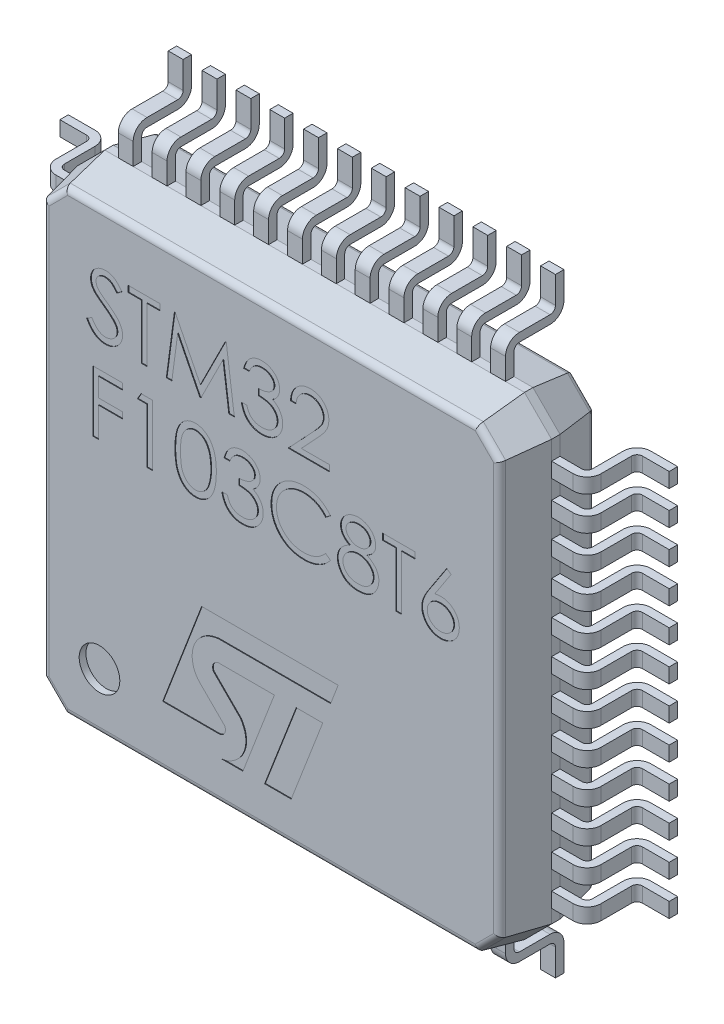
from build123d import *
from OCP.BRepFilletAPI import BRepFilletAPI_MakeChamfer

# Parameters (mm, degrees)
EXTRUDE1_DEPTH     = 1.4
CHAMFER1_SIZE      = 0.6375
CHAMFER1_SIZE2     = 0.135504808
FILLET1_R          = 0.1
SKETCH2_W          = 0.22
SKETCH2_H          = 1
EXTRUDE2_DEPTH     = 0.8625
EXTRUDE3_DEPTH     = 8.902050367
SKETCH4_W          = 1
SKETCH4_H          = 0.22
EXTRUDE4_DEPTH     = 0.8625
EXTRUDE5_DEPTH     = 9.789766777
SKETCH6_R          = 0.3
EXTRUDE6_DEPTH     = 0.1
CUT_EXTRUDE1_DEPTH = 0.01
CUT_EXTRUDE2_DEPTH = 0.01


with BuildPart() as part:
    # Sketch1 → Extrude1 (new body)
    with BuildSketch(Plane.XY.offset(0.1)):
        Polygon((-3.1, 3.5), (-3.5, 3.1), (-3.5, -3.1), (-3.1, -3.5), (3.1, -3.5), (3.5, -3.1), (3.5, 3.1), (3.1, 3.5), align=None)
    extrude(amount=EXTRUDE1_DEPTH)

    # Chamfer1: one chamfer whose edges measure the first distance from different faces: ONE call of the kernel's chamfer builder (chamfer() names one face for all edges)
    chamfer1_edges_1 = [part.edges().sort_by_distance(p)[0] for p in [
        (-3.3, 3.3, 1.5),
        (-3.3, 3.3, 0.1),
    ]]
    chamfer1_side_1 = [part.faces().sort_by_distance(p)[0] for p in [
        (-3.3, 3.3, 0.8),
    ]]
    chamfer1_edges_2 = [part.edges().sort_by_distance(p)[0] for p in [
        (0, 3.5, 1.5),
        (0, 3.5, 0.1),
    ]]
    chamfer1_side_2 = [part.faces().sort_by_distance(p)[0] for p in [
        (0, 3.5, 0.8),
    ]]
    chamfer1_edges_3 = [part.edges().sort_by_distance(p)[0] for p in [
        (3.3, 3.3, 1.5),
        (3.3, 3.3, 0.1),
    ]]
    chamfer1_side_3 = [part.faces().sort_by_distance(p)[0] for p in [
        (3.3, 3.3, 0.8),
    ]]
    chamfer1_edges_4 = [part.edges().sort_by_distance(p)[0] for p in [
        (3.5, 0, 1.5),
        (3.5, 0, 0.1),
    ]]
    chamfer1_side_4 = [part.faces().sort_by_distance(p)[0] for p in [
        (3.5, 0, 0.8),
    ]]
    chamfer1_edges_5 = [part.edges().sort_by_distance(p)[0] for p in [
        (3.3, -3.3, 1.5),
        (3.3, -3.3, 0.1),
    ]]
    chamfer1_side_5 = [part.faces().sort_by_distance(p)[0] for p in [
        (3.3, -3.3, 0.8),
    ]]
    chamfer1_edges_6 = [part.edges().sort_by_distance(p)[0] for p in [
        (0, -3.5, 1.5),
        (0, -3.5, 0.1),
    ]]
    chamfer1_side_6 = [part.faces().sort_by_distance(p)[0] for p in [
        (0, -3.5, 0.8),
    ]]
    chamfer1_edges_7 = [part.edges().sort_by_distance(p)[0] for p in [
        (-3.3, -3.3, 1.5),
        (-3.3, -3.3, 0.1),
    ]]
    chamfer1_side_7 = [part.faces().sort_by_distance(p)[0] for p in [
        (-3.3, -3.3, 0.8),
    ]]
    chamfer1_edges_8 = [part.edges().sort_by_distance(p)[0] for p in [
        (-3.5, 0, 1.5),
        (-3.5, 0, 0.1),
    ]]
    chamfer1_side_8 = [part.faces().sort_by_distance(p)[0] for p in [
        (-3.5, 0, 0.8),
    ]]
    chamfer1 = BRepFilletAPI_MakeChamfer(part.part.solid().wrapped)
    for e in chamfer1_edges_1:
        chamfer1.Add(CHAMFER1_SIZE, CHAMFER1_SIZE2, e.wrapped, chamfer1_side_1[0].wrapped)  # the first distance lies on this face
    for e in chamfer1_edges_2:
        chamfer1.Add(CHAMFER1_SIZE, CHAMFER1_SIZE2, e.wrapped, chamfer1_side_2[0].wrapped)  # the first distance lies on this face
    for e in chamfer1_edges_3:
        chamfer1.Add(CHAMFER1_SIZE, CHAMFER1_SIZE2, e.wrapped, chamfer1_side_3[0].wrapped)  # the first distance lies on this face
    for e in chamfer1_edges_4:
        chamfer1.Add(CHAMFER1_SIZE, CHAMFER1_SIZE2, e.wrapped, chamfer1_side_4[0].wrapped)  # the first distance lies on this face
    for e in chamfer1_edges_5:
        chamfer1.Add(CHAMFER1_SIZE, CHAMFER1_SIZE2, e.wrapped, chamfer1_side_5[0].wrapped)  # the first distance lies on this face
    for e in chamfer1_edges_6:
        chamfer1.Add(CHAMFER1_SIZE, CHAMFER1_SIZE2, e.wrapped, chamfer1_side_6[0].wrapped)  # the first distance lies on this face
    for e in chamfer1_edges_7:
        chamfer1.Add(CHAMFER1_SIZE, CHAMFER1_SIZE2, e.wrapped, chamfer1_side_7[0].wrapped)  # the first distance lies on this face
    for e in chamfer1_edges_8:
        chamfer1.Add(CHAMFER1_SIZE, CHAMFER1_SIZE2, e.wrapped, chamfer1_side_8[0].wrapped)  # the first distance lies on this face
    add(Compound.cast(chamfer1.Shape()), mode=Mode.REPLACE)

    # Fillet1
    fillet1_edges = [part.edges().sort_by_distance(p)[0] for p in [
        (3.204183631, 3.204183631, 1.5),
        (3.364495192, 0, 1.5),
        (3.204183631, -3.204183631, 1.5),
        (0, -3.364495192, 1.5),
        (-3.204183631, -3.204183631, 1.5),
        (-3.364495192, 0, 1.5),
        (-3.204183631, 3.204183631, 1.5),
        (0, 3.364495192, 1.5),
        (3.204183631, -3.204183631, 0.1),
        (3.364495192, 0, 0.1),
        (3.204183631, 3.204183631, 0.1),
        (0, 3.364495192, 0.1),
        (-3.204183631, 3.204183631, 0.1),
        (-3.364495192, 0, 0.1),
        (-3.204183631, -3.204183631, 0.1),
        (0, -3.364495192, 0.1),
    ]]
    fillet(fillet1_edges, radius=FILLET1_R)

    # Sketch2 → Extrude2 (add)
    with BuildSketch(Plane.XY):
        with Locations((2.21, -4)):
            Rectangle(SKETCH2_W, SKETCH2_H)
        with Locations((2.71, -4)):
            Rectangle(SKETCH2_W, SKETCH2_H)
        with Locations((1.71, -4)):
            Rectangle(SKETCH2_W, SKETCH2_H)
        with Locations((1.21, -4)):
            Rectangle(SKETCH2_W, SKETCH2_H)
        with Locations((0.71, -4)):
            Rectangle(SKETCH2_W, SKETCH2_H)
        with Locations((0.21, -4)):
            Rectangle(SKETCH2_W, SKETCH2_H)
        with Locations((-0.29, -4)):
            Rectangle(SKETCH2_W, SKETCH2_H)
        with Locations((-0.79, -4)):
            Rectangle(SKETCH2_W, SKETCH2_H)
        with Locations((-1.29, -4)):
            Rectangle(SKETCH2_W, SKETCH2_H)
        with Locations((-1.79, -4)):
            Rectangle(SKETCH2_W, SKETCH2_H)
        with Locations((-2.29, -4)):
            Rectangle(SKETCH2_W, SKETCH2_H)
        with Locations((-2.79, -4)):
            Rectangle(SKETCH2_W, SKETCH2_H)
    extrude2 = extrude(amount=EXTRUDE2_DEPTH)

    # Sketch3 → Extrude3 (cut, through all)
    with BuildSketch(Plane(origin=(2.82, 0, 0), x_dir=(0, 0, -1), z_dir=(1, 0, 0))):
        with BuildLine():
            Line((-0.6575, -3.9), (-0.205, -3.9))
            ThreePointArc((-0.205, -3.9), (-0.06004311, -3.96004311), (0, -4.105))
            Line((0, -4.105), (0, -3.5))
            Line((0, -3.5), (-0.7375, -3.5))
            Line((-0.7375, -3.5), (-0.7375, -3.82))
            ThreePointArc((-0.7375, -3.82), (-0.714068542, -3.876568542), (-0.6575, -3.9))
        make_face()
        with BuildLine():
            Line((-0.8625, -3.82), (-0.8625, -4.5))
            Line((-0.8625, -4.5), (-0.125, -4.5))
            Line((-0.125, -4.5), (-0.125, -4.105))
            ThreePointArc((-0.125, -4.105), (-0.148431458, -4.048431458), (-0.205, -4.025))
            Line((-0.205, -4.025), (-0.6575, -4.025))
            ThreePointArc((-0.6575, -4.025), (-0.80245689, -3.96495689), (-0.8625, -3.82))
        make_face()
    extrude3 = extrude(amount=-EXTRUDE3_DEPTH, mode=Mode.SUBTRACT)

    # Mirror1: Extrude2, Extrude3 across plane
    add(extrude2.mirror(Plane.ZX))
    add(extrude3.mirror(Plane.ZX), mode=Mode.SUBTRACT)

    # Sketch4 → Extrude4 (add)
    with BuildSketch(Plane.XY):
        with Locations((-4, -2.29)):
            Rectangle(SKETCH4_W, SKETCH4_H)
        with Locations((-4, -1.79)):
            Rectangle(SKETCH4_W, SKETCH4_H)
        with Locations((-4, -1.29)):
            Rectangle(SKETCH4_W, SKETCH4_H)
        with Locations((-4, -0.79)):
            Rectangle(SKETCH4_W, SKETCH4_H)
        with Locations((-4, -0.29)):
            Rectangle(SKETCH4_W, SKETCH4_H)
        with Locations((-4, 0.21)):
            Rectangle(SKETCH4_W, SKETCH4_H)
        with Locations((-4, 0.71)):
            Rectangle(SKETCH4_W, SKETCH4_H)
        with Locations((-4, 1.21)):
            Rectangle(SKETCH4_W, SKETCH4_H)
        with Locations((-4, 1.71)):
            Rectangle(SKETCH4_W, SKETCH4_H)
        with Locations((-4, 2.21)):
            Rectangle(SKETCH4_W, SKETCH4_H)
        with Locations((-4, -2.79)):
            Rectangle(SKETCH4_W, SKETCH4_H)
        with Locations((-4, 2.71)):
            Rectangle(SKETCH4_W, SKETCH4_H)
    extrude4 = extrude(amount=EXTRUDE4_DEPTH)

    # Sketch5 → Extrude5 (cut, through all)
    with BuildSketch(Plane.XZ.offset(2.9)):
        with BuildLine():
            Line((-3.9, 0.6575), (-3.9, 0.205))
            ThreePointArc((-3.9, 0.205), (-3.96004311, 0.06004311), (-4.105, 0))
            Line((-4.105, 0), (-3.5, 0))
            Line((-3.5, 0), (-3.5, 0.7375))
            Line((-3.5, 0.7375), (-3.82, 0.7375))
            ThreePointArc((-3.82, 0.7375), (-3.876568542, 0.714068542), (-3.9, 0.6575))
        make_face()
        with BuildLine():
            Line((-4.5, 0.125), (-4.105, 0.125))
            ThreePointArc((-4.105, 0.125), (-4.048431458, 0.148431458), (-4.025, 0.205))
            Line((-4.025, 0.205), (-4.025, 0.6575))
            ThreePointArc((-4.025, 0.6575), (-3.96495689, 0.80245689), (-3.82, 0.8625))
            Line((-3.82, 0.8625), (-4.5, 0.8625))
            Line((-4.5, 0.8625), (-4.5, 0.125))
        make_face()
    extrude5 = extrude(amount=-EXTRUDE5_DEPTH, mode=Mode.SUBTRACT)

    # Mirror2: Extrude4, Extrude5 across plane
    add(extrude4.mirror(Plane(origin=(0, 0, 0), x_dir=(0, 0, 1), z_dir=(1, 0, 0))))
    add(extrude5.mirror(Plane(origin=(0, 0, 0), x_dir=(0, 0, 1), z_dir=(1, 0, 0))), mode=Mode.SUBTRACT)

    # Sketch6 → Extrude6 (cut)
    with BuildSketch(Plane.XY.offset(1.5)):
        with Locations((-2.54, -2.54)):
            Circle(SKETCH6_R)
    extrude(amount=-EXTRUDE6_DEPTH, mode=Mode.SUBTRACT)

    # Sketch7 → Cut-Extrude1 (cut)
    with BuildSketch(Plane.XY.offset(1.5)):
        with BuildLine():
            Line((0.984990982, -0.984514067), (-1.030781549, -0.984514067))
            Line((-1.030781549, -0.984514067), (-1.606083468, -2.486556958))
            Line((-1.606083468, -2.486556958), (-0.778215013, -2.486556958))
            add(Edge.make_bspline(
                [(-0.778215013, -2.486556958), (-0.744994401, -2.486547034), (-0.696054932, -2.459787638), (-0.675199129, -2.390640448), (-0.683271617, -2.352639135), (-0.697392459, -2.334498886)],
                knots=[0, 0, 0, 0, 0.478706404, 0.677313917, 1, 1, 1, 1], degree=3))
            Line((-0.697392459, -2.334498886), (-1.065593925, -1.96629742))
            add(Edge.make_bspline(
                [(-1.065593925, -1.96629742), (-1.10629603, -1.923497065), (-1.15147085, -1.84101704), (-1.17664781, -1.697147627), (-1.164698077, -1.572983997), (-1.10800273, -1.457707546), (-1.017078045, -1.350892396), (-0.894506604, -1.291804621), (-0.804285084, -1.277010409), (-0.778215013, -1.273833215)],
                knots=[0, 0, 0, 0, 0.189829608, 0.294521659, 0.468645602, 0.580629443, 0.704401374, 0.91547922, 1, 1, 1, 1], degree=3))
            Line((-0.778215013, -1.273833215), (0.87438568, -1.273833215))
            Line((0.87438568, -1.273833215), (0.984990982, -0.984514067))
        make_face()
        with BuildLine():
            Line((-0.421246536, -2.787592446), (0.042974176, -1.581600869))
            Line((0.042974176, -1.581600869), (-0.770837991, -1.581600869))
            add(Edge.make_bspline(
                [(-0.770837991, -1.581600869), (-0.79196663, -1.580604982), (-0.832053586, -1.593927857), (-0.874926766, -1.653492673), (-0.869153519, -1.705811701), (-0.855566566, -1.731862722)],
                knots=[0, 0, 0, 0, 0.305418103, 0.574312298, 1, 1, 1, 1], degree=3))
            Line((-0.855566566, -1.731862722), (-0.457321592, -2.130107695))
            add(Edge.make_bspline(
                [(-0.457321592, -2.130107695), (-0.41917316, -2.186013933), (-0.376873201, -2.288839448), (-0.375158805, -2.443231861), (-0.414594547, -2.568809718), (-0.49071721, -2.669151019), (-0.597052106, -2.751486168), (-0.682489322, -2.784421126), (-0.736895813, -2.787592446)],
                knots=[0, 0, 0, 0, 0.236780891, 0.378149856, 0.532395663, 0.688335843, 0.810694545, 1, 1, 1, 1], degree=3))
            Line((-0.736895813, -2.787592446), (-0.421246536, -2.787592446))
        make_face()
        Polygon((0.366251882, -1.581600869), (0.757676742, -1.581600869), (0.291796692, -2.787592446), (-0.100366711, -2.787592446), align=None)
    extrude(amount=-CUT_EXTRUDE1_DEPTH, mode=Mode.SUBTRACT)

    # Sketch8 → Cut-Extrude2 (cut)
    # profile 1 of 13: a face of its own
    with BuildSketch(Plane.XY.offset(1.5)):
        with BuildLine():
            Line((-2.729140235, 1.854188291), (-2.653058504, 1.899801271))
            add(Edge.make_bspline(
                [(-2.653058504, 1.899801271), (-2.645982386, 1.887956144), (-2.632424817, 1.865261337), (-2.609808753, 1.834594983), (-2.586374576, 1.808530429), (-2.561948747, 1.787219301), (-2.536680361, 1.770441016), (-2.510404461, 1.758560442), (-2.483209595, 1.75115062), (-2.464702041, 1.750250598), (-2.45546235, 1.749801271)],
                knots=[0, 0, 0, 0, 1.272034388, 2.437168799, 3.508375237, 4.49857839, 5.41946034, 6.295179144, 7.148887113, 8, 8, 8, 8], degree=3))
            add(Edge.make_bspline(
                [(-2.45546235, 1.749801271), (-2.447571443, 1.750021044), (-2.431927702, 1.750456745), (-2.408897411, 1.754643237), (-2.386530662, 1.761074927), (-2.36528844, 1.770286024), (-2.345463854, 1.781430206), (-2.328079275, 1.794890651), (-2.313050275, 1.809960818), (-2.300756502, 1.826773501), (-2.291324493, 1.844855054), (-2.284075104, 1.863414584), (-2.280052085, 1.882743644), (-2.279446063, 1.895757763), (-2.279140235, 1.90232531)],
                knots=[0, 0, 0, 0, 1.095163259, 2.171163733, 3.241058638, 4.321873601, 5.38011039, 6.391990106, 7.366004449, 8.327778327, 9.272591725, 10.192022065, 11.087607919, 12, 12, 12, 12], degree=3))
            add(Edge.make_bspline(
                [(-2.279140235, 1.90232531), (-2.279519344, 1.909818671), (-2.280290016, 1.92505158), (-2.286803825, 1.947525776), (-2.297050774, 1.969766723), (-2.306504025, 1.983524191), (-2.31141187, 1.990666656)],
                knots=[0, 0, 0, 0, 0.938893495, 1.908633276, 2.914225137, 4, 4, 4, 4], degree=3))
            add(Edge.make_bspline(
                [(-2.31141187, 1.990666656), (-2.315441456, 1.995821554), (-2.323901069, 2.006643616), (-2.338444429, 2.022752391), (-2.355510002, 2.039368556), (-2.374513773, 2.057126599), (-2.396147996, 2.075200604), (-2.419735071, 2.094452447), (-2.445877206, 2.114149995), (-2.464211362, 2.127360083), (-2.473671485, 2.134176271)],
                knots=[0, 0, 0, 0, 0.722233717, 1.516239348, 2.393582979, 3.351407094, 4.387010283, 5.505090956, 6.712668013, 8, 8, 8, 8], degree=3))
            add(Edge.make_bspline(
                [(-2.473671485, 2.134176271), (-2.483140513, 2.140920765), (-2.501244572, 2.153815724), (-2.526562494, 2.172953397), (-2.549202498, 2.190450392), (-2.56906396, 2.206471424), (-2.586138142, 2.221018665), (-2.60055959, 2.233952421), (-2.611960934, 2.245622479), (-2.61830094, 2.25319311), (-2.621147447, 2.256592137)],
                knots=[0, 0, 0, 0, 1.452282411, 2.77665338, 3.964542531, 5.026858415, 5.96415736, 6.766646006, 7.446254459, 8, 8, 8, 8], degree=3))
            add(Edge.make_bspline(
                [(-2.621147447, 2.256592137), (-2.625126101, 2.261889546), (-2.632950659, 2.272307613), (-2.643279061, 2.288591148), (-2.652057702, 2.305259987), (-2.658939445, 2.322358924), (-2.664734473, 2.339647906), (-2.668632226, 2.357352512), (-2.671072871, 2.375393299), (-2.671322811, 2.387533914), (-2.671447927, 2.393611368)],
                knots=[0, 0, 0, 0, 1.068054152, 2.10047183, 3.106115577, 4.101338837, 5.06977816, 6.043150881, 7.020423561, 8, 8, 8, 8], degree=3))
            add(Edge.make_bspline(
                [(-2.671447927, 2.393611368), (-2.671112302, 2.40313331), (-2.670448226, 2.421973669), (-2.664832093, 2.449495882), (-2.655967634, 2.47577239), (-2.643548949, 2.500543047), (-2.627539915, 2.523162871), (-2.609013807, 2.543892053), (-2.586947997, 2.56131826), (-2.562737322, 2.576544218), (-2.536237112, 2.588461741), (-2.508468023, 2.597451708), (-2.479385919, 2.602545517), (-2.45968797, 2.603276513), (-2.44969312, 2.603647425)],
                knots=[0, 0, 0, 0, 1.005424448, 1.989358655, 2.955360095, 3.929531133, 4.905563448, 5.876582895, 6.856512386, 7.866279853, 8.892233794, 9.918561126, 10.94386622, 12, 12, 12, 12], degree=3))
            add(Edge.make_bspline(
                [(-2.44969312, 2.603647425), (-2.439087494, 2.603281626), (-2.417996289, 2.602554169), (-2.386972205, 2.596229089), (-2.357102307, 2.585763202), (-2.333074039, 2.573886119), (-2.314268471, 2.562023755), (-2.299926911, 2.551218657), (-2.285393853, 2.538779344), (-2.270552067, 2.52467268), (-2.25565304, 2.50876923), (-2.240475581, 2.49117791), (-2.224984198, 2.472006224), (-2.215018405, 2.458319924), (-2.209909466, 2.451303675)],
                knots=[0, 0, 0, 0, 1.286793592, 2.559021753, 3.825965368, 5.121522368, 5.803751409, 6.523245864, 7.299691795, 8.125521123, 9.008227632, 9.944561021, 10.946284179, 12, 12, 12, 12], degree=3))
            Line((-2.209909466, 2.451303675), (-2.282926293, 2.395955118))
            add(Edge.make_bspline(
                [(-2.282926293, 2.395955118), (-2.287335247, 2.401635067), (-2.295825861, 2.41257332), (-2.308716301, 2.427891659), (-2.320865953, 2.441884468), (-2.332836056, 2.454038358), (-2.343994418, 2.465018906), (-2.354824515, 2.474419987), (-2.365170491, 2.482333711), (-2.378211982, 2.490779198), (-2.394596539, 2.49915087), (-2.415163991, 2.506234919), (-2.436657604, 2.510491935), (-2.451296652, 2.511054792), (-2.458707543, 2.511339733)],
                knots=[0, 0, 0, 0, 1.181633172, 2.275549214, 3.290209073, 4.226197932, 5.078386478, 5.862611352, 6.581680152, 7.217281963, 8.414376989, 9.595101626, 10.782541182, 12, 12, 12, 12], degree=3))
            add(Edge.make_bspline(
                [(-2.458707543, 2.511339733), (-2.468004934, 2.511028153), (-2.485934078, 2.5104273), (-2.51138871, 2.503865018), (-2.534298576, 2.49353254), (-2.553983522, 2.479051546), (-2.57037303, 2.461894719), (-2.58222872, 2.442151585), (-2.589364476, 2.420350396), (-2.590235234, 2.405142541), (-2.590678697, 2.397397425)],
                knots=[0, 0, 0, 0, 1.14458467, 2.207223713, 3.21896685, 4.227309161, 5.202851033, 6.127160689, 7.046193047, 8, 8, 8, 8], degree=3))
            add(Edge.make_bspline(
                [(-2.590678697, 2.397397425), (-2.590577607, 2.392575616), (-2.590375262, 2.382924114), (-2.587553171, 2.368665177), (-2.58392763, 2.354442261), (-2.578182381, 2.340319312), (-2.570250732, 2.326049334), (-2.559835115, 2.311386601), (-2.546717406, 2.296201876), (-2.536669032, 2.286325694), (-2.531363793, 2.281111368)],
                knots=[0, 0, 0, 0, 0.858281714, 1.717966888, 2.583508476, 3.4729293, 4.427298488, 5.488583878, 6.674047936, 8, 8, 8, 8], degree=3))
            add(Edge.make_bspline(
                [(-2.531363793, 2.281111368), (-2.529393726, 2.279353275), (-2.524713297, 2.27517645), (-2.51615663, 2.268338435), (-2.504857054, 2.259903437), (-2.49110963, 2.249466698), (-2.47466088, 2.237360036), (-2.455508994, 2.22373825), (-2.433867457, 2.208159132), (-2.418510393, 2.197267193), (-2.410390235, 2.191508002)],
                knots=[0, 0, 0, 0, 0.420754252, 0.999615792, 1.744751191, 2.668019286, 3.750313428, 4.999500688, 6.413464383, 8, 8, 8, 8], degree=3))
            add(Edge.make_bspline(
                [(-2.410390235, 2.191508002), (-2.400622429, 2.184400224), (-2.381708426, 2.170636997), (-2.354796477, 2.149958679), (-2.330395212, 2.129734967), (-2.308418959, 2.110095011), (-2.288650611, 2.091187787), (-2.271309483, 2.072785826), (-2.25621888, 2.055020965), (-2.239972795, 2.03224516), (-2.223372213, 2.004272881), (-2.209115825, 1.970001334), (-2.200126536, 1.935596566), (-2.198951003, 1.912472522), (-2.198371004, 1.901063291)],
                knots=[0, 0, 0, 0, 1.163667725, 2.253281268, 3.268753668, 4.215851969, 5.092017293, 5.902905408, 6.650798638, 7.335211899, 8.59617414, 9.77448103, 10.901945474, 12, 12, 12, 12], degree=3))
            add(Edge.make_bspline(
                [(-2.198371004, 1.901063291), (-2.198539983, 1.892994568), (-2.198874658, 1.877013812), (-2.20272175, 1.853548221), (-2.208358235, 1.830757426), (-2.216853524, 1.80892314), (-2.227222336, 1.787645915), (-2.240379371, 1.767483884), (-2.255629919, 1.74799081), (-2.273124316, 1.729686484), (-2.292267548, 1.712883176), (-2.312500498, 1.697935703), (-2.333856282, 1.68547242), (-2.356219049, 1.675302203), (-2.379593936, 1.66734787), (-2.40397308, 1.661584561), (-2.429396669, 1.658047378), (-2.446676793, 1.65768024), (-2.45546235, 1.657493579)],
                knots=[0, 0, 0, 0, 0.983748083, 1.948392443, 2.894712957, 3.844097841, 4.80183111, 5.778335162, 6.776009319, 7.81870978, 8.863265674, 9.881300176, 10.883814829, 11.87499822, 12.874611388, 13.892143829, 14.928324115, 16, 16, 16, 16], degree=3))
            add(Edge.make_bspline(
                [(-2.45546235, 1.657493579), (-2.46226001, 1.657625026), (-2.47576972, 1.657886264), (-2.495752158, 1.660195736), (-2.515330909, 1.663463277), (-2.534260296, 1.668650895), (-2.552784202, 1.674944975), (-2.570822062, 1.682694832), (-2.588382619, 1.691982112), (-2.605564283, 1.702600833), (-2.622323357, 1.714958538), (-2.638502649, 1.729351723), (-2.654633011, 1.745383424), (-2.670238341, 1.763488998), (-2.685634292, 1.783375933), (-2.700517312, 1.805230295), (-2.715195468, 1.828933043), (-2.72440516, 1.845612636), (-2.729140235, 1.854188291)],
                knots=[0, 0, 0, 0, 0.915332311, 1.819136955, 2.706846663, 3.586547465, 4.459518054, 5.340707479, 6.227863349, 7.133153174, 8.059268498, 9.028702269, 10.047606654, 11.120612155, 12.245963614, 13.433783089, 14.680604001, 16, 16, 16, 16], degree=3))
        make_face()
    # profile 2 of 13: a face of its own
    with BuildSketch(Plane.XY.offset(1.5)):
        Polygon((-2.117601774, 2.48826281), (-2.117601774, 2.580570502), (-1.64452485, 2.580570502), (-1.64452485, 2.48826281), (-1.840678697, 2.48826281), (-1.840678697, 1.680570502), (-1.921447927, 1.680570502), (-1.921447927, 2.48826281), align=None)
    # profile 3 of 13: a face of its own
    with BuildSketch(Plane.XY.offset(1.5)):
        Polygon((-1.552217158, 1.680570502), (-1.433407062, 2.580570502), (-1.4218686, 2.580570502), (-1.050294081, 1.842108964), (-0.679621004, 2.580570502), (-0.667902254, 2.580570502), (-0.548371004, 1.680570502), (-0.629500812, 1.680570502), (-0.715678697, 2.328166656), (-1.040558504, 1.680570502), (-1.058767639, 1.680570502), (-1.384909466, 2.329608964), (-1.470907062, 1.680570502), align=None)
    # profile 4 of 13: a face of its own
    with BuildSketch(Plane.XY.offset(1.5)):
        with BuildLine():
            Line((-0.329140235, 2.372878194), (-0.409909466, 2.372878194))
            add(Edge.make_bspline(
                [(-0.409909466, 2.372878194), (-0.407721296, 2.381937976), (-0.403443602, 2.399649108), (-0.394521369, 2.424953832), (-0.38480156, 2.448899881), (-0.373130076, 2.471038871), (-0.360399254, 2.491815732), (-0.345813411, 2.510759221), (-0.330045482, 2.528351126), (-0.312604781, 2.543963102), (-0.294314554, 2.558100232), (-0.27491708, 2.570153818), (-0.254802622, 2.580522886), (-0.233831816, 2.589065231), (-0.211942229, 2.595500366), (-0.189331755, 2.600169259), (-0.16594114, 2.60320126), (-0.150063188, 2.60349717), (-0.142000812, 2.603647425)],
                knots=[0, 0, 0, 0, 1.162005537, 2.271625781, 3.343758855, 4.383309926, 5.390229558, 6.379919256, 7.361854164, 8.333198761, 9.295911338, 10.242430842, 11.177959212, 12.116337295, 13.062827104, 14.020064771, 14.994644689, 16, 16, 16, 16], degree=3))
            add(Edge.make_bspline(
                [(-0.142000812, 2.603647425), (-0.130253821, 2.603292766), (-0.107016075, 2.602591184), (-0.072877006, 2.596184614), (-0.039955824, 2.586046723), (-0.008612875, 2.572039193), (0.020500436, 2.554762456), (0.046404027, 2.534200095), (0.068746787, 2.510748846), (0.087491056, 2.484846186), (0.102167484, 2.457163341), (0.112989694, 2.428671872), (0.119578127, 2.399439365), (0.120431984, 2.379701779), (0.120859765, 2.369813291)],
                knots=[0, 0, 0, 0, 1.083050992, 2.142477498, 3.193116406, 4.255571735, 5.30263384, 6.308962982, 7.297363603, 8.282367274, 9.249857812, 10.179914175, 11.08814088, 12, 12, 12, 12], degree=3))
            add(Edge.make_bspline(
                [(0.120859765, 2.369813291), (0.120560556, 2.360297258), (0.11997505, 2.341675858), (0.115003526, 2.31449033), (0.106637058, 2.288868204), (0.095047691, 2.26470162), (0.080045578, 2.242143804), (0.061872598, 2.221144003), (0.040400485, 2.201609077), (0.024128759, 2.190418355), (0.015751592, 2.184657041)],
                knots=[0, 0, 0, 0, 1.024540389, 2.004866551, 2.965041327, 3.920577974, 4.882998113, 5.874504559, 6.905732034, 8, 8, 8, 8], degree=3))
            add(Edge.make_bspline(
                [(0.015751592, 2.184657041), (0.025325472, 2.180034082), (0.044294096, 2.170874665), (0.070149947, 2.152911755), (0.093621401, 2.132171552), (0.106710928, 2.115986298), (0.11328765, 2.107854156)],
                knots=[0, 0, 0, 0, 1.015518401, 2.012035669, 3.001164323, 4, 4, 4, 4], degree=3))
            add(Edge.make_bspline(
                [(0.11328765, 2.107854156), (0.11761828, 2.10192502), (0.126208625, 2.090163841), (0.136812048, 2.071254475), (0.146431535, 2.05213552), (0.153927305, 2.03229453), (0.159732014, 2.01196147), (0.163881279, 1.991101425), (0.166458916, 1.969697362), (0.166828058, 1.95521701), (0.167013611, 1.947938291)],
                knots=[0, 0, 0, 0, 1.025084078, 2.033381695, 3.024893161, 4.013698104, 4.991890475, 5.976764909, 6.982997093, 8, 8, 8, 8], degree=3))
            add(Edge.make_bspline(
                [(0.167013611, 1.947938291), (0.166552165, 1.935335791), (0.165631444, 1.910190099), (0.157401825, 1.873039456), (0.144644134, 1.836724327), (0.126526636, 1.801990797), (0.10444642, 1.769492985), (0.078177394, 1.74041622), (0.048018031, 1.715422293), (0.014382293, 1.694539663), (-0.022059254, 1.677846483), (-0.061035835, 1.666260283), (-0.101985849, 1.658714169), (-0.130067725, 1.657904974), (-0.144344562, 1.657493579)],
                knots=[0, 0, 0, 0, 0.955779014, 1.907060117, 2.875433937, 3.871313158, 4.872415639, 5.851225146, 6.836215519, 7.83643374, 8.849228613, 9.86973379, 10.916971861, 12, 12, 12, 12], degree=3))
            add(Edge.make_bspline(
                [(-0.144344562, 1.657493579), (-0.153966668, 1.657716834), (-0.172899763, 1.658156125), (-0.200733806, 1.661159194), (-0.227302243, 1.666644052), (-0.252640997, 1.674024902), (-0.276772577, 1.683382779), (-0.299623347, 1.695036158), (-0.321333891, 1.70874483), (-0.341699336, 1.72467061), (-0.360717253, 1.742485812), (-0.377882239, 1.7625067), (-0.393480472, 1.784363175), (-0.407094293, 1.808309104), (-0.419343795, 1.834035027), (-0.429418899, 1.861870355), (-0.438286616, 1.891566247), (-0.442409507, 1.912260523), (-0.44452485, 1.922878194)],
                knots=[0, 0, 0, 0, 1.048658725, 2.063410685, 3.046034179, 4.001477787, 4.936774919, 5.862367409, 6.792675028, 7.730719943, 8.675894397, 9.627829632, 10.600096036, 11.597688215, 12.626045268, 13.701542398, 14.82072376, 16, 16, 16, 16], degree=3))
            Line((-0.44452485, 1.922878194), (-0.36375562, 1.922878194))
            add(Edge.make_bspline(
                [(-0.36375562, 1.922878194), (-0.361651345, 1.915948448), (-0.357558347, 1.90246949), (-0.350591242, 1.883070554), (-0.342653686, 1.865287055), (-0.334138514, 1.848988538), (-0.325195485, 1.834014491), (-0.31518879, 1.820760868), (-0.304859581, 1.80864553), (-0.297073462, 1.801819773), (-0.293262831, 1.798479156)],
                knots=[0, 0, 0, 0, 1.198163088, 2.33053128, 3.407730985, 4.417276592, 5.372219308, 6.28897303, 7.162600585, 8, 8, 8, 8], degree=3))
            add(Edge.make_bspline(
                [(-0.293262831, 1.798479156), (-0.288223712, 1.794594156), (-0.278161027, 1.786836148), (-0.261763482, 1.776935729), (-0.244518225, 1.76835718), (-0.226051595, 1.761804229), (-0.206762082, 1.756255688), (-0.186337903, 1.752624697), (-0.164959247, 1.750133453), (-0.150361822, 1.749913614), (-0.142902254, 1.749801271)],
                knots=[0, 0, 0, 0, 0.946170439, 1.889420265, 2.845303464, 3.807233317, 4.801018734, 5.828864929, 6.890507805, 8, 8, 8, 8], degree=3))
            add(Edge.make_bspline(
                [(-0.142902254, 1.749801271), (-0.134479925, 1.749959647), (-0.118010787, 1.750269337), (-0.093979538, 1.753117376), (-0.071117623, 1.757265196), (-0.04967887, 1.763671392), (-0.029382454, 1.771586468), (-0.010512887, 1.78152463), (0.00717754, 1.793184701), (0.023462244, 1.806437627), (0.038105375, 1.820946012), (0.050998393, 1.836120801), (0.06195902, 1.851898015), (0.070800511, 1.86836496), (0.077782082, 1.885453448), (0.082534905, 1.903211432), (0.08583958, 1.921493586), (0.086108709, 1.933921036), (0.08624438, 1.940185887)],
                knots=[0, 0, 0, 0, 1.217147791, 2.380027433, 3.494444702, 4.572153297, 5.609568379, 6.639424714, 7.649109417, 8.668170816, 9.669597737, 10.625200337, 11.543417969, 12.441394052, 13.322311151, 14.205496177, 15.095365482, 16, 16, 16, 16], degree=3))
            add(Edge.make_bspline(
                [(0.08624438, 1.940185887), (0.085850874, 1.94857166), (0.08506582, 1.965301479), (0.079072185, 1.989914569), (0.06921362, 2.013629161), (0.055412117, 2.03604065), (0.038611501, 2.056811596), (0.018974811, 2.075344263), (-0.003661019, 2.090636572), (-0.0244947, 2.101202227), (-0.042948597, 2.10841176), (-0.058741125, 2.113213894), (-0.076421394, 2.117280263), (-0.095775598, 2.121063418), (-0.116949568, 2.124283193), (-0.139920252, 2.126968232), (-0.164692305, 2.129116671), (-0.181841462, 2.130076095), (-0.190678697, 2.130570502)],
                knots=[0, 0, 0, 0, 1.07054697, 2.135767047, 3.216561865, 4.33974944, 5.486079747, 6.621378074, 7.775625952, 8.963672916, 9.598146892, 10.304877434, 11.070270905, 11.915000392, 12.823868403, 13.805723172, 14.86925407, 16, 16, 16, 16], degree=3))
            Line((-0.190678697, 2.130570502), (-0.190678697, 2.222878194))
            add(Edge.make_bspline(
                [(-0.190678697, 2.222878194), (-0.179544111, 2.223067144), (-0.157734193, 2.22343725), (-0.125875658, 2.227913595), (-0.095411092, 2.234105757), (-0.067015644, 2.24359052), (-0.041134546, 2.254606597), (-0.018680934, 2.267425736), (3.0618e-05, 2.281675243), (0.014909179, 2.297575057), (0.026102409, 2.314627498), (0.034286443, 2.332400353), (0.039120813, 2.351049397), (0.039766155, 2.363776597), (0.040090534, 2.370173868)],
                knots=[0, 0, 0, 0, 1.321986639, 2.589447074, 3.816329219, 5.01088745, 6.139805852, 7.153945165, 8.075214402, 8.924034688, 9.728124013, 10.488707548, 11.240355623, 12, 12, 12, 12], degree=3))
            add(Edge.make_bspline(
                [(0.040090534, 2.370173868), (0.039983971, 2.374873859), (0.03977197, 2.38422427), (0.037098384, 2.397885002), (0.033080773, 2.411128102), (0.027557414, 2.423897253), (0.020164506, 2.436103895), (0.011317253, 2.447852096), (0.000782598, 2.459074782), (-0.011289088, 2.469535436), (-0.024252124, 2.479504668), (-0.038459209, 2.487968175), (-0.053481977, 2.495205476), (-0.069337059, 2.501173634), (-0.08607591, 2.505663165), (-0.103619882, 2.508886668), (-0.122002429, 2.510902064), (-0.134543732, 2.511192229), (-0.140919081, 2.511339733)],
                knots=[0, 0, 0, 0, 0.884392785, 1.759457502, 2.611959086, 3.489218968, 4.37281399, 5.2945488, 6.255912374, 7.266815255, 8.301784654, 9.332968512, 10.37626691, 11.440494194, 12.520033166, 13.637162961, 14.798855837, 16, 16, 16, 16], degree=3))
            add(Edge.make_bspline(
                [(-0.140919081, 2.511339733), (-0.151166653, 2.510981954), (-0.171182544, 2.510283129), (-0.200037808, 2.504162354), (-0.22686278, 2.494396561), (-0.247367009, 2.482739499), (-0.262508242, 2.471232245), (-0.273328026, 2.461182488), (-0.2839533, 2.450014048), (-0.293685046, 2.437039037), (-0.303526925, 2.423136148), (-0.312486955, 2.40759863), (-0.321193733, 2.390831786), (-0.326440103, 2.378978623), (-0.329140235, 2.372878194)],
                knots=[0, 0, 0, 0, 1.472543308, 2.876219568, 4.221790263, 5.565193594, 6.249813518, 6.953379497, 7.687249741, 8.463570142, 9.283606569, 10.136032583, 11.040678096, 12, 12, 12, 12], degree=3))
        make_face()
    # profile 5 of 13: a face of its own
    with BuildSketch(Plane.XY.offset(1.5)):
        with BuildLine():
            Line((0.363167457, 2.303647425), (0.282398226, 2.303647425))
            add(Edge.make_bspline(
                [(0.282398226, 2.303647425), (0.282924637, 2.314362796), (0.283958494, 2.3354075), (0.288800054, 2.36609079), (0.295727708, 2.395419167), (0.305522654, 2.423157145), (0.317687125, 2.449549981), (0.332274846, 2.474492842), (0.349553265, 2.497890577), (0.369149282, 2.519526279), (0.390432647, 2.539374512), (0.413397031, 2.556514431), (0.43752861, 2.570996118), (0.462754169, 2.583102723), (0.489358314, 2.592190112), (0.51709962, 2.598932819), (0.54609997, 2.602989594), (0.565858833, 2.603425653), (0.575907842, 2.603647425)],
                knots=[0, 0, 0, 0, 1.10065271, 2.161652631, 3.183658789, 4.190468796, 5.17591951, 6.163126047, 7.15150782, 8.156236427, 9.156009102, 10.134482811, 11.092018607, 12.041330605, 13.001268258, 13.972401359, 14.968799086, 16, 16, 16, 16], degree=3))
            add(Edge.make_bspline(
                [(0.575907842, 2.603647425), (0.585776489, 2.603416394), (0.60516803, 2.602962425), (0.63346969, 2.599063874), (0.660412423, 2.592957865), (0.685943563, 2.584391044), (0.709859408, 2.572875048), (0.73233962, 2.559041395), (0.753651828, 2.54304201), (0.77283643, 2.524205315), (0.790452793, 2.504096131), (0.805650516, 2.482627812), (0.818665329, 2.460454568), (0.82951359, 2.437407316), (0.837499454, 2.413269051), (0.843562422, 2.388391199), (0.846989471, 2.362516248), (0.847515437, 2.345003133), (0.847782842, 2.336099348)],
                knots=[0, 0, 0, 0, 1.111607364, 2.184268762, 3.212621178, 4.221274766, 5.211760367, 6.196651075, 7.1921475, 8.207485113, 9.220403448, 10.201281604, 11.166441695, 12.114753415, 13.065576456, 14.026450734, 14.996634279, 16, 16, 16, 16], degree=3))
            add(Edge.make_bspline(
                [(0.847782842, 2.336099348), (0.847347431, 2.323564191), (0.846484251, 2.29871385), (0.839100555, 2.262195743), (0.827568595, 2.226814578), (0.81368356, 2.198339271), (0.79967636, 2.175393516), (0.787053858, 2.156501563), (0.772277192, 2.136160157), (0.755131293, 2.114437413), (0.73597084, 2.09116318), (0.714622284, 2.066351519), (0.690933388, 2.040258778), (0.674306917, 2.022437338), (0.665691496, 2.013202714)],
                knots=[0, 0, 0, 0, 1.184426356, 2.348067706, 3.509069118, 4.696110526, 5.333549288, 6.050745305, 6.844228056, 7.710549037, 8.667450064, 9.695053472, 10.805634456, 12, 12, 12, 12], degree=3))
            Line((0.665691496, 2.013202714), (0.440511207, 1.772878194))
            Line((0.440511207, 1.772878194), (0.859321303, 1.772878194))
            Line((0.859321303, 1.772878194), (0.859321303, 1.680570502))
            Line((0.859321303, 1.680570502), (0.247782842, 1.680570502))
            Line((0.247782842, 1.680570502), (0.596821303, 2.053046464))
            add(Edge.make_bspline(
                [(0.596821303, 2.053046464), (0.605319331, 2.061917457), (0.621642304, 2.078956819), (0.644729252, 2.10383358), (0.665464992, 2.126912034), (0.68398375, 2.148148575), (0.699883795, 2.167853835), (0.713993797, 2.185389616), (0.725299235, 2.201526475), (0.737568908, 2.220231204), (0.749452503, 2.243068657), (0.759664252, 2.27097732), (0.765890927, 2.299707185), (0.766637885, 2.319121994), (0.767013611, 2.32888781)],
                knots=[0, 0, 0, 0, 1.329631726, 2.553950428, 3.673215718, 4.687767853, 5.603093632, 6.413772471, 7.123043292, 7.734684054, 8.834405432, 9.900288307, 10.943827018, 12, 12, 12, 12], degree=3))
            add(Edge.make_bspline(
                [(0.767013611, 2.32888781), (0.766850135, 2.335028741), (0.766527954, 2.347131337), (0.763684546, 2.364875675), (0.759387558, 2.381992341), (0.753230206, 2.398533986), (0.745102759, 2.414334297), (0.735209604, 2.429412506), (0.723795016, 2.443989668), (0.710590404, 2.457657659), (0.696084585, 2.470175683), (0.680760349, 2.481264734), (0.664547465, 2.490531934), (0.647514291, 2.498128833), (0.629708313, 2.504088217), (0.611095093, 2.508217566), (0.59172606, 2.510810205), (0.578500304, 2.511160992), (0.571761207, 2.511339733)],
                knots=[0, 0, 0, 0, 0.991446411, 1.95395049, 2.89581595, 3.838931463, 4.798493298, 5.75982156, 6.748411868, 7.785213223, 8.824556874, 9.840280684, 10.836137867, 11.835679398, 12.848801643, 13.863922112, 14.911575587, 16, 16, 16, 16], degree=3))
            add(Edge.make_bspline(
                [(0.571761207, 2.511339733), (0.564722993, 2.511155868), (0.550901103, 2.510794786), (0.530607637, 2.508268958), (0.511248437, 2.503911456), (0.492774805, 2.49795174), (0.475155483, 2.490376685), (0.458476157, 2.480941665), (0.442774271, 2.469683052), (0.428020308, 2.456918338), (0.414426714, 2.442706669), (0.402483231, 2.426864107), (0.392047342, 2.409679914), (0.38294211, 2.391200458), (0.37554779, 2.371258058), (0.369897552, 2.349923505), (0.365426648, 2.327289436), (0.363933028, 2.311658985), (0.363167457, 2.303647425)],
                knots=[0, 0, 0, 0, 1.031018746, 2.02475058, 2.990194455, 3.934040569, 4.864654155, 5.795059489, 6.735614925, 7.690564532, 8.649604399, 9.611025574, 10.590972636, 11.591080095, 12.624614302, 13.701020113, 14.821632451, 16, 16, 16, 16], degree=3))
        make_face()
    # profile 6 of 13: a face of its own
    with BuildSketch(Plane.XY.offset(1.5)):
        Polygon((-2.636832543, 1.28996707), (-2.198371004, 1.28996707), (-2.198371004, 1.197659378), (-2.556063312, 1.197659378), (-2.556063312, 0.920736301), (-2.198371004, 0.920736301), (-2.198371004, 0.828428608), (-2.556063312, 0.828428608), (-2.556063312, 0.38996707), (-2.636832543, 0.38996707), align=None)
    # profile 7 of 13: a face of its own
    with BuildSketch(Plane.XY.offset(1.5)):
        Polygon((-1.926315716, 1.28996707), (-1.759909466, 1.28996707), (-1.759909466, 0.38996707), (-1.840678697, 0.38996707), (-1.840678697, 1.197659378), (-1.979140235, 1.197659378), align=None)
    # profile 8 of 13: a face of its own
    with BuildSketch(Plane.XY.offset(1.5)):
        with BuildLine():
            add(Edge.make_bspline(
                [(-1.425294081, 0.839606493), (-1.425209734, 0.854031536), (-1.425045887, 0.882052389), (-1.423223151, 0.922882725), (-1.420195205, 0.9611868), (-1.416045595, 0.996966445), (-1.410995829, 1.030230899), (-1.404254704, 1.060891265), (-1.396588555, 1.08908945), (-1.38770364, 1.114917405), (-1.377678208, 1.1387231), (-1.366766541, 1.160946723), (-1.354535594, 1.181554649), (-1.341684388, 1.200875795), (-1.327692713, 1.218593888), (-1.312958738, 1.234959144), (-1.296907398, 1.249593337), (-1.280084339, 1.262925243), (-1.262337248, 1.27461225), (-1.244171991, 1.284906383), (-1.225463535, 1.293700634), (-1.206160803, 1.300615318), (-1.186437288, 1.306326678), (-1.166224042, 1.310232408), (-1.145487691, 1.312689899), (-1.131491037, 1.312924842), (-1.124392639, 1.313043993)],
                knots=[0, 0, 0, 0, 1.646270934, 3.197905019, 4.663502075, 6.030701355, 7.308322542, 8.50163776, 9.611534131, 10.641858119, 11.616356847, 12.558055219, 13.465016945, 14.349605745, 15.204443733, 16.039544428, 16.859896111, 17.680448484, 18.487036065, 19.28249412, 20.06191084, 20.843045899, 21.620316918, 22.403196591, 23.190181807, 24, 24, 24, 24], degree=3))
            add(Edge.make_bspline(
                [(-1.124392639, 1.313043993), (-1.117234944, 1.312918555), (-1.103000542, 1.312669098), (-1.081955874, 1.310271513), (-1.061397385, 1.306293224), (-1.04141272, 1.300656402), (-1.021837724, 1.293663228), (-1.002825505, 1.284897969), (-0.984257969, 1.274694832), (-0.966430181, 1.262705835), (-0.949146423, 1.249338964), (-0.932831233, 1.234228563), (-0.917483125, 1.217527207), (-0.902909475, 1.199413585), (-0.88952375, 1.179540277), (-0.876776296, 1.158252935), (-0.865366344, 1.135179284), (-0.854377427, 1.110704306), (-0.844892202, 1.084150794), (-0.836338025, 1.055668427), (-0.82942629, 1.024920779), (-0.823669048, 0.992069173), (-0.819208932, 0.956992963), (-0.815960539, 0.919767339), (-0.814244603, 0.88036781), (-0.813921451, 0.853430077), (-0.81375562, 0.839606493)],
                knots=[0, 0, 0, 0, 0.810914788, 1.612654377, 2.396697861, 3.181598691, 3.963628158, 4.749916497, 5.551656086, 6.361998678, 7.18212741, 8.025565596, 8.878627764, 9.750805457, 10.657531673, 11.591944965, 12.560506719, 13.57287815, 14.630710178, 15.753379473, 16.941251878, 18.199788006, 19.531962791, 20.947069417, 22.433333509, 24, 24, 24, 24], degree=3))
            add(Edge.make_bspline(
                [(-0.81375562, 0.839606493), (-0.81392317, 0.825843202), (-0.814249635, 0.799025992), (-0.815941302, 0.759803741), (-0.819273522, 0.722775673), (-0.823441805, 0.687852983), (-0.829214909, 0.655181023), (-0.836313381, 0.624646737), (-0.844194892, 0.596118261), (-0.853923839, 0.56982931), (-0.864572308, 0.545413152), (-0.87615793, 0.522613028), (-0.888570171, 0.50122741), (-0.902092991, 0.481427475), (-0.916506725, 0.463072963), (-0.932119871, 0.446487861), (-0.948492307, 0.431272545), (-0.965826929, 0.417733555), (-0.983932756, 0.405883177), (-1.002436519, 0.395285329), (-1.021666532, 0.386739779), (-1.041187005, 0.379402197), (-1.061277156, 0.373796367), (-1.081911943, 0.369920233), (-1.102986403, 0.367201757), (-1.11723252, 0.366994377), (-1.124392639, 0.366890147)],
                knots=[0, 0, 0, 0, 1.561518951, 3.042555995, 4.452378317, 5.7783523, 7.031515105, 8.214008947, 9.334062868, 10.386615937, 11.391082383, 12.354592575, 13.286541444, 14.194233754, 15.072674879, 15.931287219, 16.775624067, 17.606195743, 18.42308326, 19.229000347, 20.022332153, 20.807536673, 21.593273796, 22.3848459, 23.188221202, 24, 24, 24, 24], degree=3))
            add(Edge.make_bspline(
                [(-1.124392639, 0.366890147), (-1.13149084, 0.367010067), (-1.145487106, 0.367246526), (-1.166226301, 0.369692914), (-1.186356072, 0.373626043), (-1.205975752, 0.37913317), (-1.225185999, 0.385874128), (-1.243725044, 0.394656504), (-1.26179902, 0.404770978), (-1.279359705, 0.416289801), (-1.296077118, 0.429486805), (-1.312045331, 0.444083337), (-1.326863193, 0.460443643), (-1.340654818, 0.478309394), (-1.35376244, 0.497516228), (-1.365819708, 0.518326381), (-1.376972213, 0.540657338), (-1.387166254, 0.564653372), (-1.396204481, 0.590664639), (-1.404188178, 0.618988714), (-1.410491818, 0.649875592), (-1.415887435, 0.6830772), (-1.42023942, 0.718736211), (-1.423210532, 0.756871983), (-1.42504687, 0.797460751), (-1.425210174, 0.82530155), (-1.425294081, 0.839606493)],
                knots=[0, 0, 0, 0, 0.810891512, 1.598919785, 2.382837074, 3.152667961, 3.926044502, 4.706494248, 5.493654104, 6.291793342, 7.103789334, 7.925228297, 8.761435821, 9.622817696, 10.50288917, 11.416980706, 12.369136599, 13.353924996, 14.394355917, 15.514179734, 16.714354668, 17.994756427, 19.357759367, 20.818452758, 22.365282078, 24, 24, 24, 24], degree=3))
        make_face()
        with BuildLine():
            add(Edge.make_bspline(
                [(-1.34452485, 0.83996707), (-1.344494135, 0.827945976), (-1.344434524, 0.804615393), (-1.342877215, 0.77071284), (-1.340755727, 0.739091899), (-1.338019393, 0.709712418), (-1.333955778, 0.682673843), (-1.329402604, 0.65779021), (-1.323861667, 0.635193206), (-1.317305805, 0.614727769), (-1.309838609, 0.59604658), (-1.301685672, 0.578663411), (-1.292927201, 0.562372913), (-1.283125133, 0.547321414), (-1.272449831, 0.533459828), (-1.261142422, 0.520542814), (-1.2487809, 0.509023591), (-1.231679938, 0.495208114), (-1.209103701, 0.480931765), (-1.180658442, 0.468499913), (-1.151429411, 0.460687282), (-1.131590518, 0.459693744), (-1.121688312, 0.459197839)],
                knots=[0, 0, 0, 0, 1.459021318, 2.831673884, 4.118529203, 5.306027144, 6.411944654, 7.436330062, 8.375795394, 9.233974572, 10.042671642, 10.816086306, 11.563610507, 12.285937304, 12.993564865, 13.685989202, 14.367179055, 15.041617293, 16.353048772, 17.594441528, 18.799311195, 20, 20, 20, 20], degree=3))
            add(Edge.make_bspline(
                [(-1.121688312, 0.459197839), (-1.111722054, 0.459608697), (-1.091810113, 0.460429565), (-1.062718566, 0.46834924), (-1.034476497, 0.48029855), (-1.012343712, 0.494427909), (-0.995505344, 0.507883765), (-0.983440975, 0.519356103), (-0.972367877, 0.532201897), (-0.961865629, 0.546061716), (-0.952233295, 0.561200355), (-0.943474202, 0.577545017), (-0.935481342, 0.595141092), (-0.930927587, 0.607424739), (-0.92859937, 0.613705051)],
                knots=[0, 0, 0, 0, 1.353760809, 2.704726607, 4.075137775, 5.516104923, 6.260822281, 7.007110065, 7.778089737, 8.566572457, 9.372053459, 10.217411131, 11.088608312, 12, 12, 12, 12], degree=3))
            add(Edge.make_bspline(
                [(-0.92859937, 0.613705051), (-0.925886058, 0.621735555), (-0.920376872, 0.638040923), (-0.913276701, 0.663334434), (-0.907685027, 0.689872287), (-0.902654447, 0.717495889), (-0.899220804, 0.746408955), (-0.896457081, 0.776522025), (-0.89482919, 0.807857804), (-0.894627397, 0.829147944), (-0.89452485, 0.83996707)],
                knots=[0, 0, 0, 0, 0.884706709, 1.796334032, 2.740027952, 3.714592787, 4.726048262, 5.777819803, 6.87074269, 8, 8, 8, 8], degree=3))
            add(Edge.make_bspline(
                [(-0.89452485, 0.83996707), (-0.894666328, 0.850784446), (-0.894943087, 0.871945545), (-0.89600097, 0.902935935), (-0.898732746, 0.932370502), (-0.901766805, 0.960376052), (-0.906240377, 0.986797558), (-0.911063813, 1.011856208), (-0.917544124, 1.035241557), (-0.924466352, 1.057319736), (-0.932389025, 1.077839904), (-0.941110214, 1.096897735), (-0.950424381, 1.114585235), (-0.960540957, 1.130853877), (-0.971339847, 1.145776531), (-0.983106074, 1.159053998), (-0.995372912, 1.17109779), (-1.012554474, 1.184845308), (-1.035047863, 1.198862601), (-1.063036744, 1.211762368), (-1.092163481, 1.219170215), (-1.111853798, 1.220214648), (-1.121688312, 1.220736301)],
                knots=[0, 0, 0, 0, 1.31362396, 2.569729283, 3.763502607, 4.902122613, 5.988968491, 7.01645872, 7.998833611, 8.933434873, 9.825090667, 10.667526885, 11.477055099, 12.250526234, 12.991942729, 13.710640831, 14.402115721, 15.076753259, 16.378508321, 17.609869233, 18.806226677, 20, 20, 20, 20], degree=3))
            add(Edge.make_bspline(
                [(-1.121688312, 1.220736301), (-1.131642464, 1.220213929), (-1.151568903, 1.219168233), (-1.180998377, 1.211789968), (-1.209208067, 1.198929491), (-1.231641975, 1.184798881), (-1.24883552, 1.171340458), (-1.260942498, 1.159669655), (-1.272294371, 1.146903476), (-1.28275178, 1.132914412), (-1.292546167, 1.11788046), (-1.301541285, 1.101683349), (-1.309645741, 1.084240999), (-1.317124622, 1.065568201), (-1.323700481, 1.04510453), (-1.329124643, 1.02253536), (-1.3341356, 0.997730873), (-1.337682955, 0.970545857), (-1.340836492, 0.941159018), (-1.342863124, 0.909459136), (-1.344439733, 0.875499724), (-1.34449591, 0.852048511), (-1.34452485, 0.83996707)],
                knots=[0, 0, 0, 0, 1.207732386, 2.417664972, 3.655092373, 4.956220595, 5.625982001, 6.301752483, 6.994047911, 7.697131622, 8.419323945, 9.170223765, 9.943494443, 10.752040957, 11.610060368, 12.549350801, 13.567764191, 14.679664412, 15.874934091, 17.154273443, 18.533957287, 20, 20, 20, 20], degree=3))
        make_face(mode=Mode.SUBTRACT)
    # profile 9 of 13: a face of its own
    with BuildSketch(Plane.XY.offset(1.5)):
        with BuildLine():
            Line((-0.617601774, 1.082274762), (-0.698371004, 1.082274762))
            add(Edge.make_bspline(
                [(-0.698371004, 1.082274762), (-0.696182834, 1.091334544), (-0.69190514, 1.109045676), (-0.682982907, 1.1343504), (-0.673263099, 1.158296448), (-0.661591615, 1.180435439), (-0.648860792, 1.2012123), (-0.63427495, 1.220155789), (-0.618507021, 1.237747694), (-0.60106632, 1.253359669), (-0.582776092, 1.2674968), (-0.563378619, 1.279550386), (-0.54326416, 1.289919454), (-0.522293355, 1.298461799), (-0.500403768, 1.304896934), (-0.477793293, 1.309565827), (-0.454402679, 1.312597828), (-0.438524727, 1.312893738), (-0.43046235, 1.313043993)],
                knots=[0, 0, 0, 0, 1.162005537, 2.271625781, 3.343758855, 4.383309926, 5.390229558, 6.379919256, 7.361854164, 8.333198761, 9.295911338, 10.242430842, 11.177959212, 12.116337295, 13.062827104, 14.020064771, 14.994644689, 16, 16, 16, 16], degree=3))
            add(Edge.make_bspline(
                [(-0.43046235, 1.313043993), (-0.41871536, 1.312689334), (-0.395477614, 1.311987752), (-0.361338545, 1.305581182), (-0.328417363, 1.295443291), (-0.297074413, 1.281435761), (-0.267961102, 1.264159024), (-0.242057511, 1.243596663), (-0.219714751, 1.220145414), (-0.200970483, 1.194242754), (-0.186294054, 1.166559909), (-0.175471844, 1.13806844), (-0.168883412, 1.108835933), (-0.168029554, 1.089098347), (-0.167601774, 1.079209858)],
                knots=[0, 0, 0, 0, 1.083050992, 2.142477498, 3.193116406, 4.255571735, 5.30263384, 6.308962982, 7.297363603, 8.282367274, 9.249857812, 10.179914175, 11.08814088, 12, 12, 12, 12], degree=3))
            add(Edge.make_bspline(
                [(-0.167601774, 1.079209858), (-0.167900983, 1.069693826), (-0.168486488, 1.051072426), (-0.173458013, 1.023886898), (-0.18182448, 0.998264772), (-0.193413848, 0.974098188), (-0.208415961, 0.951540372), (-0.22658894, 0.930540571), (-0.248061053, 0.911005645), (-0.26433278, 0.899814923), (-0.272709947, 0.894053608)],
                knots=[0, 0, 0, 0, 1.024540389, 2.004866551, 2.965041327, 3.920577974, 4.882998113, 5.874504559, 6.905732034, 8, 8, 8, 8], degree=3))
            add(Edge.make_bspline(
                [(-0.272709947, 0.894053608), (-0.263136067, 0.88943065), (-0.244167442, 0.880271232), (-0.218311592, 0.862308323), (-0.194840138, 0.84156812), (-0.18175061, 0.825382866), (-0.175173889, 0.817250724)],
                knots=[0, 0, 0, 0, 1.015518401, 2.012035669, 3.001164323, 4, 4, 4, 4], degree=3))
            add(Edge.make_bspline(
                [(-0.175173889, 0.817250724), (-0.170843258, 0.811321588), (-0.162252913, 0.799560409), (-0.15164949, 0.780651042), (-0.142030004, 0.761532088), (-0.134534233, 0.741691098), (-0.128729525, 0.721358037), (-0.124580259, 0.700497993), (-0.122002623, 0.67909393), (-0.121633481, 0.664613578), (-0.121447927, 0.657334858)],
                knots=[0, 0, 0, 0, 1.025084078, 2.033381695, 3.024893161, 4.013698104, 4.991890475, 5.976764909, 6.982997093, 8, 8, 8, 8], degree=3))
            add(Edge.make_bspline(
                [(-0.121447927, 0.657334858), (-0.121909374, 0.644732359), (-0.122830095, 0.619586667), (-0.131059714, 0.582436024), (-0.143817404, 0.546120895), (-0.161934902, 0.511387365), (-0.184015119, 0.478889553), (-0.210284145, 0.449812787), (-0.240443507, 0.424818861), (-0.274079245, 0.40393623), (-0.310520793, 0.387243051), (-0.349497374, 0.375656851), (-0.390447387, 0.368110737), (-0.418529264, 0.367301542), (-0.4328061, 0.366890147)],
                knots=[0, 0, 0, 0, 0.955779014, 1.907060117, 2.875433937, 3.871313158, 4.872415639, 5.851225146, 6.836215519, 7.83643374, 8.849228613, 9.86973379, 10.916971861, 12, 12, 12, 12], degree=3))
            add(Edge.make_bspline(
                [(-0.4328061, 0.366890147), (-0.442428206, 0.367113402), (-0.461361302, 0.367552693), (-0.489195344, 0.370555762), (-0.515763781, 0.37604062), (-0.541102535, 0.38342147), (-0.565234116, 0.392779347), (-0.588084886, 0.404432726), (-0.60979543, 0.418141398), (-0.630160874, 0.434067178), (-0.649178792, 0.451882379), (-0.666343778, 0.471903268), (-0.68194201, 0.493759743), (-0.695555832, 0.517705672), (-0.707805334, 0.543431595), (-0.717880437, 0.571266923), (-0.726748155, 0.600962815), (-0.730871045, 0.621657091), (-0.732986389, 0.632274762)],
                knots=[0, 0, 0, 0, 1.048658725, 2.063410685, 3.046034179, 4.001477787, 4.936774919, 5.862367409, 6.792675028, 7.730719943, 8.675894397, 9.627829632, 10.600096036, 11.597688215, 12.626045268, 13.701542398, 14.82072376, 16, 16, 16, 16], degree=3))
            Line((-0.732986389, 0.632274762), (-0.652217158, 0.632274762))
            add(Edge.make_bspline(
                [(-0.652217158, 0.632274762), (-0.650112883, 0.625345016), (-0.646019886, 0.611866058), (-0.63905278, 0.592467122), (-0.631115225, 0.574683622), (-0.622600053, 0.558385105), (-0.613657024, 0.543411059), (-0.603650329, 0.530157436), (-0.59332112, 0.518042098), (-0.585535, 0.51121634), (-0.58172437, 0.507875724)],
                knots=[0, 0, 0, 0, 1.198163088, 2.33053128, 3.407730985, 4.417276592, 5.372219308, 6.28897303, 7.162600585, 8, 8, 8, 8], degree=3))
            add(Edge.make_bspline(
                [(-0.58172437, 0.507875724), (-0.57668525, 0.503990724), (-0.566622565, 0.496232715), (-0.55022502, 0.486332297), (-0.532979764, 0.477753747), (-0.514513133, 0.471200797), (-0.495223621, 0.465652256), (-0.474799441, 0.462021265), (-0.453420785, 0.459530021), (-0.43882336, 0.459310181), (-0.431363793, 0.459197839)],
                knots=[0, 0, 0, 0, 0.946170439, 1.889420265, 2.845303464, 3.807233317, 4.801018734, 5.828864929, 6.890507805, 8, 8, 8, 8], degree=3))
            add(Edge.make_bspline(
                [(-0.431363793, 0.459197839), (-0.422941463, 0.459356215), (-0.406472326, 0.459665905), (-0.382441076, 0.462513944), (-0.359579161, 0.466661764), (-0.338140409, 0.47306796), (-0.317843993, 0.480983036), (-0.298974426, 0.490921197), (-0.281283998, 0.502581269), (-0.264999294, 0.515834195), (-0.250356163, 0.53034258), (-0.237463146, 0.545517369), (-0.226502519, 0.561294583), (-0.217661027, 0.577761528), (-0.210679457, 0.594850015), (-0.205926634, 0.612608), (-0.202621959, 0.630890154), (-0.20235283, 0.643317603), (-0.202217158, 0.649582455)],
                knots=[0, 0, 0, 0, 1.217147791, 2.380027433, 3.494444702, 4.572153297, 5.609568379, 6.639424714, 7.649109417, 8.668170816, 9.669597737, 10.625200337, 11.543417969, 12.441394052, 13.322311151, 14.205496177, 15.095365482, 16, 16, 16, 16], degree=3))
            add(Edge.make_bspline(
                [(-0.202217158, 0.649582455), (-0.202610664, 0.657968227), (-0.203395718, 0.674698047), (-0.209389353, 0.699311137), (-0.219247918, 0.723025729), (-0.233049421, 0.745437218), (-0.249850037, 0.766208164), (-0.269486727, 0.784740831), (-0.292122558, 0.80003314), (-0.312956238, 0.810598795), (-0.331410136, 0.817808328), (-0.347202663, 0.822610462), (-0.364882932, 0.82667683), (-0.384237136, 0.830459986), (-0.405411106, 0.833679761), (-0.42838179, 0.8363648), (-0.453153843, 0.838513239), (-0.470303, 0.839472663), (-0.479140235, 0.83996707)],
                knots=[0, 0, 0, 0, 1.07054697, 2.135767047, 3.216561865, 4.33974944, 5.486079747, 6.621378074, 7.775625952, 8.963672916, 9.598146892, 10.304877434, 11.070270905, 11.915000392, 12.823868403, 13.805723172, 14.86925407, 16, 16, 16, 16], degree=3))
            Line((-0.479140235, 0.83996707), (-0.479140235, 0.932274762))
            add(Edge.make_bspline(
                [(-0.479140235, 0.932274762), (-0.46800565, 0.932463712), (-0.446195732, 0.932833818), (-0.414337196, 0.937310163), (-0.38387263, 0.943502325), (-0.355477182, 0.952987088), (-0.329596085, 0.964003165), (-0.307142473, 0.976822304), (-0.288430921, 0.991071811), (-0.273552359, 1.006971625), (-0.262359129, 1.024024066), (-0.254175096, 1.041796921), (-0.249340726, 1.060445965), (-0.248695383, 1.073173165), (-0.248371004, 1.079570435)],
                knots=[0, 0, 0, 0, 1.321986639, 2.589447074, 3.816329219, 5.01088745, 6.139805852, 7.153945165, 8.075214402, 8.924034688, 9.728124013, 10.488707548, 11.240355623, 12, 12, 12, 12], degree=3))
            add(Edge.make_bspline(
                [(-0.248371004, 1.079570435), (-0.248477567, 1.084270427), (-0.248689569, 1.093620837), (-0.251363154, 1.107281569), (-0.255380765, 1.12052467), (-0.260904124, 1.133293821), (-0.268297032, 1.145500463), (-0.277144286, 1.157248664), (-0.28767894, 1.16847135), (-0.299750627, 1.178932004), (-0.312713662, 1.188901236), (-0.326920747, 1.197364743), (-0.341943515, 1.204602044), (-0.357798598, 1.210570202), (-0.374537448, 1.215059733), (-0.39208142, 1.218283235), (-0.410463967, 1.220298632), (-0.42300527, 1.220588796), (-0.42938062, 1.220736301)],
                knots=[0, 0, 0, 0, 0.884392785, 1.759457502, 2.611959086, 3.489218968, 4.37281399, 5.2945488, 6.255912374, 7.266815255, 8.301784654, 9.332968512, 10.37626691, 11.440494194, 12.520033166, 13.637162961, 14.798855837, 16, 16, 16, 16], degree=3))
            add(Edge.make_bspline(
                [(-0.42938062, 1.220736301), (-0.439628191, 1.220378522), (-0.459644083, 1.219679697), (-0.488499347, 1.213558922), (-0.515324318, 1.203793129), (-0.535828547, 1.192136067), (-0.55096978, 1.180628812), (-0.561789564, 1.170579056), (-0.572414839, 1.159410616), (-0.582146584, 1.146435605), (-0.591988464, 1.132532716), (-0.600948494, 1.116995198), (-0.609655272, 1.100228353), (-0.614901642, 1.08837519), (-0.617601774, 1.082274762)],
                knots=[0, 0, 0, 0, 1.472543308, 2.876219568, 4.221790263, 5.565193594, 6.249813518, 6.953379497, 7.687249741, 8.463570142, 9.283606569, 10.136032583, 11.040678096, 12, 12, 12, 12], degree=3))
        make_face()
    # profile 10 of 13: a face of its own
    with BuildSketch(Plane.XY.offset(1.5)):
        with BuildLine():
            Line((0.870859765, 1.124822839), (0.800186688, 1.070736301))
            add(Edge.make_bspline(
                [(0.800186688, 1.070736301), (0.795145174, 1.076744693), (0.785130116, 1.088680471), (0.76901775, 1.105440926), (0.752225899, 1.121143421), (0.734760982, 1.135862762), (0.716308637, 1.149084216), (0.69731586, 1.161496785), (0.677464934, 1.172622775), (0.650014488, 1.186113257), (0.614105041, 1.20019084), (0.568900654, 1.211994528), (0.521712086, 1.219508545), (0.489518418, 1.220322361), (0.473143419, 1.220736301)],
                knots=[0, 0, 0, 0, 0.757959112, 1.505699292, 2.245454638, 2.979532153, 3.711538275, 4.438200793, 5.171680507, 5.909471876, 7.393775596, 8.890124382, 10.418191784, 12, 12, 12, 12], degree=3))
            add(Edge.make_bspline(
                [(0.473143419, 1.220736301), (0.464121999, 1.220632425), (0.446162887, 1.220425637), (0.419510422, 1.217697576), (0.393355637, 1.213863265), (0.367715546, 1.208173896), (0.342622785, 1.200980937), (0.31791331, 1.19238583), (0.293944871, 1.181751729), (0.270385895, 1.169998176), (0.247814098, 1.156722547), (0.226457086, 1.142241971), (0.206392751, 1.126718489), (0.187605222, 1.110093919), (0.170075293, 1.092443129), (0.153929984, 1.073578013), (0.139225164, 1.053558882), (0.125669358, 1.03264972), (0.113528941, 1.010911431), (0.103364115, 0.988263556), (0.094362797, 0.965093929), (0.087240135, 0.941140774), (0.081602402, 0.916572634), (0.077712432, 0.891323574), (0.075015396, 0.865446342), (0.074809636, 0.847906805), (0.074705919, 0.839065628)],
                knots=[0, 0, 0, 0, 1.054917814, 2.100044995, 3.131103042, 4.146048494, 5.169673617, 6.183595914, 7.203665975, 8.234915748, 9.262203917, 10.264457458, 11.251630812, 12.227803204, 13.197192746, 14.159520551, 15.12972552, 16.100847026, 17.073214652, 18.039054194, 19.002613845, 19.979014051, 20.95965708, 21.949030935, 22.966165397, 24, 24, 24, 24], degree=3))
            add(Edge.make_bspline(
                [(0.074705919, 0.839065628), (0.075030387, 0.825763288), (0.075667436, 0.799645909), (0.081337008, 0.761390609), (0.089952602, 0.724742436), (0.102865179, 0.689930477), (0.118787221, 0.65652547), (0.138906235, 0.625092622), (0.162207631, 0.595156934), (0.189021053, 0.567425891), (0.218439691, 0.54209379), (0.25000344, 0.519786497), (0.283633685, 0.501191242), (0.318959105, 0.485717427), (0.356251534, 0.47382284), (0.395443912, 0.465449208), (0.436450996, 0.459986933), (0.464471699, 0.459463985), (0.478732361, 0.459197839)],
                knots=[0, 0, 0, 0, 1.029171465, 2.020641659, 2.987623507, 3.938342917, 4.889210282, 5.84687017, 6.821220943, 7.821438502, 8.827599549, 9.822697543, 10.807740252, 11.797342354, 12.80366471, 13.83203677, 14.896651826, 16, 16, 16, 16], degree=3))
            add(Edge.make_bspline(
                [(0.478732361, 0.459197839), (0.494444481, 0.459632097), (0.525369692, 0.46048682), (0.57072147, 0.46772777), (0.614136381, 0.479468377), (0.655616761, 0.495899271), (0.69504567, 0.517258917), (0.732484811, 0.543152657), (0.767965786, 0.573826799), (0.789301259, 0.597248175), (0.800186688, 0.609197839)],
                knots=[0, 0, 0, 0, 1.028121516, 2.023589091, 2.998037872, 3.967518031, 4.937445131, 5.927275754, 6.942489185, 8, 8, 8, 8], degree=3))
            Line((0.800186688, 0.609197839), (0.870859765, 0.555652166))
            add(Edge.make_bspline(
                [(0.870859765, 0.555652166), (0.865172251, 0.548313707), (0.853824466, 0.53367194), (0.835449547, 0.513030643), (0.816092528, 0.49361532), (0.795609631, 0.475582503), (0.774236485, 0.458571354), (0.751589319, 0.443065169), (0.727965853, 0.428847513), (0.70344613, 0.415829161), (0.678056201, 0.404279012), (0.651826489, 0.3943909), (0.624870055, 0.385873071), (0.597185668, 0.378865431), (0.568715902, 0.373395723), (0.539563494, 0.369739236), (0.509665526, 0.367234172), (0.489494875, 0.367005851), (0.479273226, 0.366890147)],
                knots=[0, 0, 0, 0, 0.986787822, 1.968848986, 2.935600012, 3.899624008, 4.868462664, 5.837806735, 6.815139263, 7.798259679, 8.787526145, 9.778297419, 10.776456485, 11.791383307, 12.812564526, 13.85620153, 14.913611965, 16, 16, 16, 16], degree=3))
            add(Edge.make_bspline(
                [(0.479273226, 0.366890147), (0.469593426, 0.366957516), (0.45045282, 0.367090731), (0.422193141, 0.369248717), (0.394681535, 0.372192935), (0.367996631, 0.376626112), (0.341992809, 0.381857514), (0.316905801, 0.388870122), (0.292488747, 0.396725622), (0.268839746, 0.405958333), (0.24593868, 0.41637678), (0.223859414, 0.428151752), (0.202612103, 0.441184232), (0.181987852, 0.455186949), (0.16229133, 0.470609684), (0.143351852, 0.487238247), (0.125063216, 0.505016592), (0.113748239, 0.517836412), (0.108059284, 0.524281974)],
                knots=[0, 0, 0, 0, 1.114604814, 2.203992996, 3.262667896, 4.300477797, 5.318619304, 6.316056647, 7.298880507, 8.271930387, 9.238335007, 10.195173496, 11.151986948, 12.108099108, 13.064862484, 14.031167946, 15.010108607, 16, 16, 16, 16], degree=3))
            add(Edge.make_bspline(
                [(0.108059284, 0.524281974), (0.098947262, 0.53547828), (0.080833225, 0.557735719), (0.057658049, 0.593809257), (0.037820106, 0.631472511), (0.021780584, 0.67092335), (0.009241595, 0.71207325), (0.000555002, 0.754942953), (-0.005089696, 0.799492424), (-0.005735199, 0.829793313), (-0.006063312, 0.845195435)],
                knots=[0, 0, 0, 0, 0.994628077, 1.977248131, 2.950237994, 3.925870899, 4.908910175, 5.911660606, 6.938484602, 8, 8, 8, 8], degree=3))
            add(Edge.make_bspline(
                [(-0.006063312, 0.845195435), (-0.005663405, 0.861383981), (-0.004876613, 0.893233933), (0.00180802, 0.939975806), (0.012561425, 0.984757595), (0.02783491, 1.0274957), (0.047199144, 1.068414915), (0.071120273, 1.107202654), (0.099320395, 1.144106974), (0.131578341, 1.17856791), (0.166952799, 1.210078029), (0.204834779, 1.237799624), (0.245150137, 1.260869842), (0.287454728, 1.28015457), (0.332065331, 1.294977432), (0.378886769, 1.305353966), (0.427831062, 1.311812653), (0.461224257, 1.312629135), (0.478191496, 1.313043993)],
                knots=[0, 0, 0, 0, 1.032925535, 2.032216505, 3.007276963, 3.968222605, 4.92396291, 5.891752235, 6.871517503, 7.883894988, 8.900124299, 9.891468569, 10.874487609, 11.85992873, 12.854644235, 13.869047385, 14.917252991, 16, 16, 16, 16], degree=3))
            add(Edge.make_bspline(
                [(0.478191496, 1.313043993), (0.48853236, 1.312920015), (0.509001059, 1.312674612), (0.539280313, 1.310281604), (0.568759768, 1.306292391), (0.597459735, 1.300862544), (0.625519836, 1.294123519), (0.652725613, 1.285344585), (0.679236703, 1.27530662), (0.704885908, 1.263745871), (0.729550164, 1.250768709), (0.753221789, 1.236518978), (0.775712753, 1.221014342), (0.797181314, 1.204386668), (0.817268339, 1.186284182), (0.836544148, 1.1672048), (0.85435414, 1.146598959), (0.865347818, 1.132094833), (0.870859765, 1.124822839)],
                knots=[0, 0, 0, 0, 1.096760587, 2.17092713, 3.219439832, 4.250915756, 5.268269357, 6.278326846, 7.281116186, 8.274029601, 9.260640565, 10.235837813, 11.203064059, 12.156899882, 13.114053108, 14.069676657, 15.032185724, 16, 16, 16, 16], degree=3))
        make_face()
    # profile 11 of 13: a face of its own
    with BuildSketch(Plane.XY.offset(1.5)):
        with BuildLine():
            add(Edge.make_bspline(
                [(1.412266015, 0.891349282), (1.419632784, 0.887508093), (1.434000445, 0.880016492), (1.454463155, 0.867953708), (1.47316387, 0.855240317), (1.490621443, 0.84247681), (1.506529162, 0.829174386), (1.520709154, 0.815280145), (1.533511684, 0.801140902), (1.544678572, 0.786517229), (1.554500615, 0.771447976), (1.56298945, 0.755893592), (1.570245302, 0.739888163), (1.575995772, 0.723256978), (1.580732804, 0.70624434), (1.583992246, 0.688630573), (1.585745167, 0.670531742), (1.586076577, 0.658299893), (1.58624438, 0.652106493)],
                knots=[0, 0, 0, 0, 1.272397273, 2.481599622, 3.635517121, 4.734568067, 5.792894095, 6.808321871, 7.773003508, 8.711915296, 9.623354172, 10.525449501, 11.423591555, 12.311487226, 13.218079475, 14.126165749, 15.051214107, 16, 16, 16, 16], degree=3))
            add(Edge.make_bspline(
                [(1.58624438, 0.652106493), (1.586046015, 0.643441362), (1.585653376, 0.626289816), (1.58223338, 0.600975101), (1.5771129, 0.576389215), (1.569635311, 0.552537546), (1.559937582, 0.529551707), (1.547986395, 0.507412022), (1.5344578, 0.485755628), (1.523592938, 0.472430639), (1.518095342, 0.465688224)],
                knots=[0, 0, 0, 0, 1.025265484, 2.029385089, 3.018602448, 3.995076438, 4.983346944, 5.966715145, 6.97116228, 8, 8, 8, 8], degree=3))
            add(Edge.make_bspline(
                [(1.518095342, 0.465688224), (1.510937391, 0.457821253), (1.496709943, 0.442184527), (1.47233719, 0.42188289), (1.445588706, 0.404821617), (1.416567992, 0.390917416), (1.385352623, 0.380095338), (1.35194925, 0.37231869), (1.316292754, 0.367864351), (1.291785633, 0.367220468), (1.27921313, 0.366890147)],
                knots=[0, 0, 0, 0, 0.954267603, 1.896743057, 2.838368354, 3.796610408, 4.779680527, 5.799409237, 6.871065594, 8, 8, 8, 8], degree=3))
            add(Edge.make_bspline(
                [(1.27921313, 0.366890147), (1.267123973, 0.367186498), (1.243599702, 0.367763168), (1.209359104, 0.371670308), (1.177441744, 0.378517473), (1.147662037, 0.387888944), (1.120199516, 0.400080146), (1.095132433, 0.415253737), (1.072099126, 0.432798965), (1.051798604, 0.453219728), (1.033775862, 0.475091752), (1.017944076, 0.497656452), (1.004785028, 0.520915887), (0.993643775, 0.544523238), (0.985114855, 0.568809392), (0.979207715, 0.593649395), (0.975456177, 0.618999861), (0.974957028, 0.636108), (0.974705919, 0.644714666)],
                knots=[0, 0, 0, 0, 1.256902934, 2.445805442, 3.576955095, 4.645999104, 5.686449165, 6.692658513, 7.68621702, 8.689161843, 9.678783111, 10.630372946, 11.551080876, 12.453998257, 13.34127905, 14.221779781, 15.105423033, 16, 16, 16, 16], degree=3))
            add(Edge.make_bspline(
                [(0.974705919, 0.644714666), (0.974854517, 0.651029887), (0.975148199, 0.663510992), (0.977180874, 0.681950534), (0.980448764, 0.699898111), (0.98488691, 0.717420017), (0.990901746, 0.734388687), (0.998164008, 0.750884523), (1.006632225, 0.766926148), (1.016424524, 0.782601289), (1.027816473, 0.797690307), (1.040715698, 0.812449277), (1.055380007, 0.826649185), (1.071646262, 0.840463523), (1.089328572, 0.854137345), (1.108886223, 0.866931675), (1.129800749, 0.879752295), (1.144664996, 0.887417293), (1.152290053, 0.891349282)],
                knots=[0, 0, 0, 0, 0.941657376, 1.861047343, 2.762797495, 3.66048619, 4.553285746, 5.444104102, 6.34607688, 7.256116206, 8.197091036, 9.162375105, 10.176350973, 11.237807142, 12.343728897, 13.50695164, 14.721116704, 16, 16, 16, 16], degree=3))
            add(Edge.make_bspline(
                [(1.152290053, 0.891349282), (1.141852271, 0.897041079), (1.121641804, 0.908061993), (1.09488109, 0.928311171), (1.07189493, 0.950242324), (1.053315145, 0.974318557), (1.038690858, 0.999787753), (1.028657503, 1.026490561), (1.021869835, 1.053931847), (1.021197451, 1.072679155), (1.020859765, 1.082094474)],
                knots=[0, 0, 0, 0, 1.166880483, 2.259407225, 3.286803203, 4.280235371, 5.237608625, 6.161067461, 7.076446754, 8, 8, 8, 8], degree=3))
            add(Edge.make_bspline(
                [(1.020859765, 1.082094474), (1.021280303, 1.091685275), (1.022125657, 1.110964457), (1.028961368, 1.139663174), (1.040100813, 1.167850291), (1.055251927, 1.195389188), (1.074122925, 1.221347815), (1.096763466, 1.244629773), (1.122632885, 1.265024154), (1.151602051, 1.282143741), (1.182777083, 1.296076682), (1.215669697, 1.305688276), (1.249706796, 1.311971849), (1.27287478, 1.312683275), (1.284621784, 1.313043993)],
                knots=[0, 0, 0, 0, 0.888701115, 1.786444228, 2.72001202, 3.692817113, 4.693886446, 5.687152267, 6.695133018, 7.739871481, 8.800368666, 9.853104506, 10.91144658, 12, 12, 12, 12], degree=3))
            add(Edge.make_bspline(
                [(1.284621784, 1.313043993), (1.296065622, 1.312672076), (1.318631567, 1.311938699), (1.351801615, 1.305822073), (1.38353944, 1.295605911), (1.413735597, 1.281746625), (1.441849506, 1.264675697), (1.4666901, 1.244001187), (1.488632764, 1.220821931), (1.506783036, 1.194871176), (1.521739208, 1.167438097), (1.532153725, 1.138735163), (1.53882709, 1.109382548), (1.539668812, 1.089521347), (1.540090534, 1.079570435)],
                knots=[0, 0, 0, 0, 1.072916533, 2.115669174, 3.151510826, 4.193348718, 5.225979165, 6.227137561, 7.216255879, 8.211077061, 9.189680878, 10.138522389, 11.067357538, 12, 12, 12, 12], degree=3))
            add(Edge.make_bspline(
                [(1.540090534, 1.079570435), (1.539721647, 1.069805008), (1.538997174, 1.050626262), (1.532902904, 1.022668014), (1.52263948, 0.996485204), (1.508626696, 0.971780731), (1.490362999, 0.949002631), (1.468092182, 0.927861253), (1.441991802, 0.908182926), (1.422381859, 0.897077861), (1.412266015, 0.891349282)],
                knots=[0, 0, 0, 0, 0.975232327, 1.915300861, 2.843280834, 3.77672583, 4.742871857, 5.749627742, 6.839139064, 8, 8, 8, 8], degree=3))
        make_face()
        with BuildLine():
            add(Edge.make_bspline(
                [(1.280114573, 1.220736301), (1.273801508, 1.220568787), (1.261450394, 1.220241058), (1.243340164, 1.218528837), (1.226118698, 1.21519801), (1.209606064, 1.210765199), (1.194028655, 1.204776859), (1.179174912, 1.197732428), (1.165297635, 1.189168011), (1.1522293, 1.179560846), (1.140464815, 1.168994099), (1.130023645, 1.157984857), (1.121350701, 1.146316899), (1.113985844, 1.134280463), (1.108642026, 1.121518315), (1.104639776, 1.108421727), (1.101934275, 1.094825199), (1.101731546, 1.085532954), (1.101628996, 1.080832455)],
                knots=[0, 0, 0, 0, 1.203892937, 2.355340988, 3.463153438, 4.544400666, 5.610487187, 6.640501085, 7.674077295, 8.714426146, 9.728707835, 10.68524104, 11.601827946, 12.495867327, 13.368432065, 14.231010473, 15.105153427, 16, 16, 16, 16], degree=3))
            add(Edge.make_bspline(
                [(1.101628996, 1.080832455), (1.101805747, 1.076131752), (1.102155034, 1.066842489), (1.104856352, 1.05312498), (1.108882401, 1.039645131), (1.115221142, 1.026723468), (1.12282392, 1.013911747), (1.132207442, 1.001530168), (1.143390335, 0.98953564), (1.155997391, 0.978030184), (1.169731787, 0.967256216), (1.184281969, 0.957903113), (1.199465327, 0.950077198), (1.215125859, 0.943563923), (1.231423174, 0.938500796), (1.24825741, 0.934908859), (1.265631397, 0.932676345), (1.277403546, 0.932409682), (1.283359765, 0.932274762)],
                knots=[0, 0, 0, 0, 0.873023192, 1.725219244, 2.590779336, 3.480155217, 4.391973325, 5.357036234, 6.360879153, 7.436073238, 8.526419356, 9.601555421, 10.645666583, 11.697338044, 12.750135903, 13.812665442, 14.89329948, 16, 16, 16, 16], degree=3))
            add(Edge.make_bspline(
                [(1.283359765, 0.932274762), (1.291009792, 0.932499214), (1.306234286, 0.9329459), (1.328677543, 0.937099059), (1.350499366, 0.943632009), (1.371466513, 0.952570286), (1.391036263, 0.963788879), (1.408480852, 0.977220226), (1.423651482, 0.992554194), (1.436390496, 1.009552066), (1.446267313, 1.027642475), (1.45395635, 1.045796836), (1.458446376, 1.064208838), (1.459032037, 1.0765432), (1.459321303, 1.082635339)],
                knots=[0, 0, 0, 0, 1.076279235, 2.141928126, 3.20205304, 4.278698113, 5.344010996, 6.36967002, 7.368914609, 8.37248503, 9.349703398, 10.264243087, 11.142681841, 12, 12, 12, 12], degree=3))
            add(Edge.make_bspline(
                [(1.459321303, 1.082635339), (1.45918453, 1.08691112), (1.458913054, 1.095397932), (1.456675896, 1.107930654), (1.452979254, 1.120178261), (1.447974462, 1.132241931), (1.441389086, 1.143952405), (1.433581152, 1.15549377), (1.424096566, 1.166606395), (1.413451769, 1.177549251), (1.401380092, 1.187676571), (1.3879048, 1.196582639), (1.373094979, 1.204145817), (1.356950277, 1.210288639), (1.339530154, 1.214902387), (1.320914844, 1.218357447), (1.300949129, 1.220304819), (1.28721005, 1.220589354), (1.280114573, 1.220736301)],
                knots=[0, 0, 0, 0, 0.814439003, 1.616544685, 2.417341072, 3.248991801, 4.09997495, 4.973547432, 5.9003056, 6.880240646, 7.880314356, 8.896779544, 9.951930927, 11.043077905, 12.18215768, 13.381699519, 14.647792085, 16, 16, 16, 16], degree=3))
        make_face(mode=Mode.SUBTRACT)
        with BuildLine():
            add(Edge.make_bspline(
                [(1.285342938, 0.83996707), (1.277339165, 0.839824705), (1.261637714, 0.83954542), (1.238634504, 0.836436691), (1.216557976, 0.832109133), (1.195482563, 0.82554406), (1.175417167, 0.81700782), (1.156253163, 0.806738938), (1.138137158, 0.794600396), (1.121319314, 0.780746409), (1.105961887, 0.765816835), (1.092488038, 0.750012286), (1.081045819, 0.733626492), (1.071831554, 0.716451347), (1.064268537, 0.698850533), (1.059302112, 0.680385723), (1.056118243, 0.661411893), (1.055690709, 0.648513582), (1.05547515, 0.642010339)],
                knots=[0, 0, 0, 0, 1.140299081, 2.23698856, 3.303958914, 4.344563908, 5.37730929, 6.408454204, 7.439741482, 8.480804886, 9.510774543, 10.48932336, 11.43758569, 12.353841022, 13.263987381, 14.161954604, 15.073269652, 16, 16, 16, 16], degree=3))
            add(Edge.make_bspline(
                [(1.05547515, 0.642010339), (1.055825702, 0.633928106), (1.056521189, 0.617893145), (1.062038611, 0.594194069), (1.070893463, 0.571251512), (1.083242804, 0.549252439), (1.098534465, 0.52869384), (1.117338414, 0.510773869), (1.138486058, 0.494851203), (1.162692935, 0.481973352), (1.189134541, 0.47168896), (1.217803842, 0.464603141), (1.248289393, 0.459912483), (1.269339002, 0.459439808), (1.280114573, 0.459197839)],
                knots=[0, 0, 0, 0, 0.898778495, 1.783155532, 2.693654817, 3.627872908, 4.583023416, 5.533784346, 6.509005473, 7.520592997, 8.575161974, 9.658835044, 10.801527049, 12, 12, 12, 12], degree=3))
            add(Edge.make_bspline(
                [(1.280114573, 0.459197839), (1.288536096, 0.459359533), (1.304943924, 0.459674564), (1.32888031, 0.462455382), (1.351468909, 0.466865286), (1.372665914, 0.47327934), (1.392708616, 0.481109334), (1.411257192, 0.491182155), (1.428788814, 0.502638467), (1.444439588, 0.516230564), (1.458693842, 0.530753863), (1.471122403, 0.546128446), (1.481911487, 0.561936465), (1.490379447, 0.578535161), (1.497149055, 0.595606082), (1.502015112, 0.613306642), (1.505017568, 0.631691131), (1.505321227, 0.64416232), (1.50547515, 0.650483897)],
                knots=[0, 0, 0, 0, 1.224942928, 2.386581632, 3.501229538, 4.569074225, 5.605009692, 6.626002462, 7.634866581, 8.645888296, 9.63523824, 10.59253846, 11.518950513, 12.414518923, 13.29783783, 14.186679152, 15.080837789, 16, 16, 16, 16], degree=3))
            add(Edge.make_bspline(
                [(1.50547515, 0.650483897), (1.505242217, 0.656623784), (1.504782915, 0.66873057), (1.501867766, 0.686670534), (1.49674654, 0.704002686), (1.489719495, 0.720935545), (1.480364391, 0.737126018), (1.469347138, 0.752995891), (1.456054365, 0.768104691), (1.441033983, 0.782569773), (1.424664536, 0.795945248), (1.407264413, 0.807777532), (1.388967551, 0.817742362), (1.369812669, 0.825846604), (1.349842297, 0.832220524), (1.329071125, 0.836673209), (1.307474835, 0.839475964), (1.292803582, 0.839801518), (1.285342938, 0.83996707)],
                knots=[0, 0, 0, 0, 0.917430815, 1.809013306, 2.70690318, 3.612392954, 4.541220862, 5.495268465, 6.494511384, 7.542276156, 8.608045339, 9.649016899, 10.681629292, 11.715607085, 12.752076957, 13.808767841, 14.885711793, 16, 16, 16, 16], degree=3))
        make_face(mode=Mode.SUBTRACT)
    # profile 12 of 13: a face of its own
    with BuildSketch(Plane.XY.offset(1.5)):
        Polygon((1.643936688, 1.197659378), (1.643936688, 1.28996707), (2.117013611, 1.28996707), (2.117013611, 1.197659378), (1.920859765, 1.197659378), (1.920859765, 0.38996707), (1.840090534, 0.38996707), (1.840090534, 1.197659378), align=None)
    # profile 13 of 13: a face of its own
    with BuildSketch(Plane.XY.offset(1.5)):
        with BuildLine():
            Line((2.590090534, 1.313043993), (2.652290053, 1.26418582))
            Line((2.652290053, 1.26418582), (2.414489573, 0.900543993))
            add(Edge.make_bspline(
                [(2.414489573, 0.900543993), (2.43032193, 0.903067557), (2.461204732, 0.907990054), (2.492464534, 0.908802098), (2.507698707, 0.909197839)],
                knots=[0, 0, 0, 0, 1.025318673, 2, 2, 2, 2], degree=3))
            add(Edge.make_bspline(
                [(2.507698707, 0.909197839), (2.516845921, 0.908951982), (2.534851938, 0.908468019), (2.561287973, 0.9047436), (2.586690842, 0.898874286), (2.610955257, 0.890318563), (2.634168309, 0.879389386), (2.656463211, 0.866290819), (2.677420871, 0.850346502), (2.697311174, 0.832535513), (2.71536957, 0.812808288), (2.731357699, 0.791876516), (2.744787445, 0.769762004), (2.755683597, 0.746475953), (2.764144851, 0.722054257), (2.770313103, 0.696528164), (2.773959284, 0.669880072), (2.77445441, 0.651757112), (2.774705919, 0.642551205)],
                knots=[0, 0, 0, 0, 1.04369286, 2.054478336, 3.041073146, 4.015093852, 4.984733326, 5.965804835, 6.960378782, 7.985147595, 9.009457201, 10.008161701, 10.986880575, 11.956520048, 12.937015923, 13.931873656, 14.949455224, 16, 16, 16, 16], degree=3))
            add(Edge.make_bspline(
                [(2.774705919, 0.642551205), (2.774339978, 0.629956424), (2.773619892, 0.605172875), (2.76644463, 0.569076008), (2.755295007, 0.534687647), (2.739357928, 0.502556831), (2.719562458, 0.472727599), (2.695422506, 0.446297051), (2.66779418, 0.422724755), (2.636554718, 0.403013053), (2.602935099, 0.386915126), (2.567616014, 0.375352635), (2.530940462, 0.368234029), (2.506047848, 0.367341588), (2.493455919, 0.366890147)],
                knots=[0, 0, 0, 0, 1.031375318, 2.029502543, 3.004789286, 3.987476834, 4.960371455, 5.9300674, 6.912260825, 7.929083631, 8.949397511, 9.960523116, 10.96833055, 12, 12, 12, 12], degree=3))
            add(Edge.make_bspline(
                [(2.493455919, 0.366890147), (2.481345339, 0.367283114), (2.4573564, 0.368061513), (2.422067967, 0.374995612), (2.388160334, 0.386234581), (2.355871064, 0.401718253), (2.32596005, 0.421275994), (2.299200315, 0.44482058), (2.275725287, 0.471848728), (2.256188956, 0.502356246), (2.240693853, 0.535139378), (2.229073587, 0.569323218), (2.222285981, 0.604783213), (2.221337495, 0.628821221), (2.220859765, 0.640928608)],
                knots=[0, 0, 0, 0, 1.012016664, 2.004627821, 2.994792927, 3.992885782, 4.990978636, 5.973936114, 6.964471063, 7.975201453, 8.993600317, 9.990122807, 10.98767138, 12, 12, 12, 12], degree=3))
            add(Edge.make_bspline(
                [(2.220859765, 0.640928608), (2.221163565, 0.650197216), (2.221783867, 0.66912194), (2.226115024, 0.697784119), (2.233074543, 0.72711154), (2.240868606, 0.75199119), (2.249103763, 0.772372724), (2.255957274, 0.78880505), (2.26448773, 0.80571504), (2.273583742, 0.823682547), (2.28406408, 0.842244515), (2.295459532, 0.861711173), (2.308085157, 0.881772926), (2.316936056, 0.895387148), (2.321460726, 0.902346878)],
                knots=[0, 0, 0, 0, 1.173818275, 2.396712641, 3.66331629, 4.989737886, 5.693666774, 6.447286557, 7.243889047, 8.091586357, 8.998013824, 9.943181721, 10.948533338, 12, 12, 12, 12], degree=3))
            Line((2.321460726, 0.902346878), (2.590090534, 1.313043993))
        make_face()
        with BuildLine():
            add(Edge.make_bspline(
                [(2.490751592, 0.816890147), (2.483895586, 0.816690079), (2.470503815, 0.816299287), (2.450856194, 0.814029936), (2.432261358, 0.809756462), (2.414472952, 0.804313691), (2.397823543, 0.796830047), (2.382192127, 0.787739585), (2.367518256, 0.777036996), (2.353955629, 0.764873905), (2.341659144, 0.751556982), (2.33106971, 0.73729339), (2.321935379, 0.722426881), (2.314508626, 0.706833239), (2.308725463, 0.690518425), (2.304542199, 0.673557475), (2.302214091, 0.655836653), (2.301826775, 0.643819724), (2.301628996, 0.637683416)],
                knots=[0, 0, 0, 0, 1.129588631, 2.206414736, 3.251139165, 4.268635594, 5.265702196, 6.250456724, 7.242448911, 8.251968645, 9.246821453, 10.222880186, 11.173611482, 12.116736599, 13.062300278, 14.020270554, 14.989073742, 16, 16, 16, 16], degree=3))
            add(Edge.make_bspline(
                [(2.301628996, 0.637683416), (2.30179006, 0.631601993), (2.302105883, 0.619677227), (2.304973623, 0.602104295), (2.309354073, 0.585193318), (2.315870174, 0.569031479), (2.323642803, 0.553372426), (2.333904172, 0.538783352), (2.345274202, 0.524378191), (2.358865214, 0.511263527), (2.373451221, 0.499060395), (2.389034388, 0.488394044), (2.40527552, 0.479269028), (2.422393886, 0.472117603), (2.440146613, 0.466248501), (2.458681613, 0.462118406), (2.478011776, 0.459783414), (2.491105988, 0.459395593), (2.497782842, 0.459197839)],
                knots=[0, 0, 0, 0, 0.989467248, 1.94019797, 2.891935182, 3.827694429, 4.772920941, 5.730924762, 6.725747692, 7.756678648, 8.79901574, 9.819492441, 10.826891316, 11.826466727, 12.835195252, 13.867842842, 14.912794438, 16, 16, 16, 16], degree=3))
            add(Edge.make_bspline(
                [(2.497782842, 0.459197839), (2.504459684, 0.459395608), (2.517553876, 0.45978346), (2.536884194, 0.462118232), (2.555418619, 0.466249141), (2.573173435, 0.472115282), (2.590284089, 0.479277639), (2.606511017, 0.488337275), (2.621946813, 0.499125991), (2.636542395, 0.511242673), (2.650076837, 0.524452835), (2.661719566, 0.538654763), (2.671666683, 0.553490337), (2.679749759, 0.568969794), (2.686194091, 0.585203091), (2.690596754, 0.602101677), (2.693458572, 0.619677912), (2.693775209, 0.631602224), (2.693936688, 0.637683416)],
                knots=[0, 0, 0, 0, 1.087397944, 2.132534446, 3.165364764, 4.174271784, 5.174024072, 6.181601208, 7.194203697, 8.236725232, 9.267838612, 10.269026844, 11.221737037, 12.171628256, 13.107553087, 14.05945871, 15.010357665, 16, 16, 16, 16], degree=3))
            add(Edge.make_bspline(
                [(2.693936688, 0.637683416), (2.693795184, 0.643827729), (2.693517458, 0.655887018), (2.690376214, 0.673549548), (2.686019604, 0.690604601), (2.67944111, 0.706944988), (2.67089457, 0.722506226), (2.660484551, 0.737366924), (2.64844189, 0.751641013), (2.634531094, 0.764900021), (2.619387891, 0.777023555), (2.603286741, 0.787725727), (2.586441833, 0.796757864), (2.568870248, 0.804293976), (2.550370649, 0.809732412), (2.531241705, 0.814014674), (2.511238757, 0.816293479), (2.497667629, 0.816688724), (2.490751592, 0.816890147)],
                knots=[0, 0, 0, 0, 0.978206639, 1.919901502, 2.851605144, 3.780102724, 4.718870031, 5.675451981, 6.667674623, 7.690630536, 8.733308323, 9.756129687, 10.767539656, 11.776269907, 12.797430371, 13.836405707, 14.897401972, 16, 16, 16, 16], degree=3))
        make_face(mode=Mode.SUBTRACT)
    extrude(amount=-CUT_EXTRUDE2_DEPTH, mode=Mode.SUBTRACT)


solid = part.part
